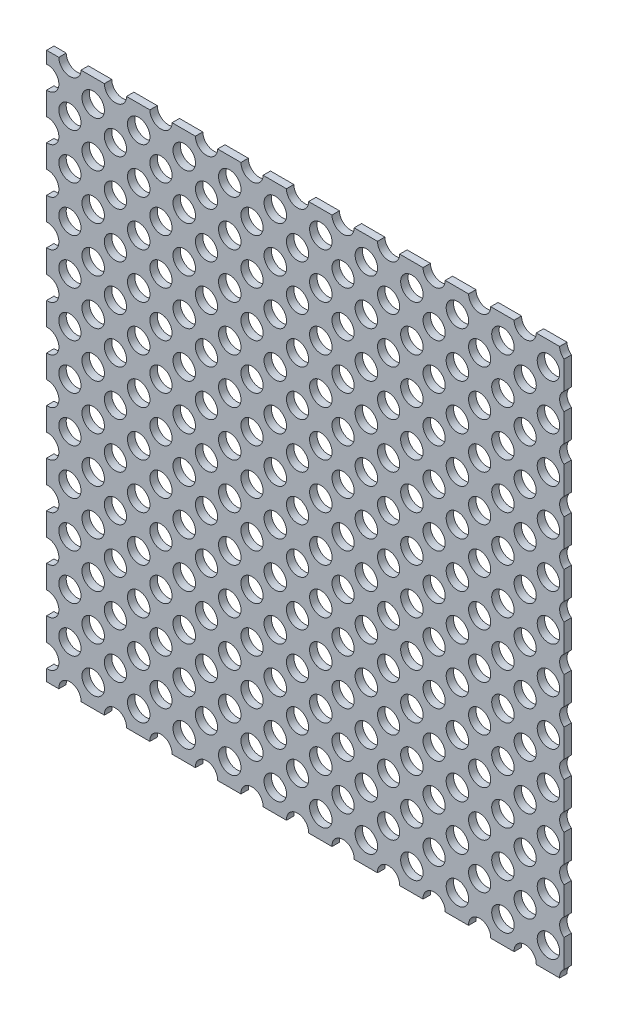
from build123d import *

# Parameters (mm, degrees)
SKETCH1_W                     = 222.25
SKETCH1_H                     = 234.95
BOSS_EXTRUDE1_DEPTH           = 3.175
SKETCH2_R                     = 4.7625
SKETCH2_R_2                   = 4.826
CUT_EXTRUDE1_DEPTH            = 3.175
LPATTERN1_COUNT               = 16
LPATTERN1_PITCH               = 19.558
LPATTERN1_COL_COUNT           = 2
LPATTERN1_COL_PITCH           = 19.558
LPATTERN2_COPY_1_SKETCH_R     = 4.7625
LPATTERN2_COPY_1_SKETCH_R_2   = 4.826
LPATTERN2_COPY_1_DEPTH        = 3.175
LPATTERN2_COPY_2_SKETCH_R     = 4.7625
LPATTERN2_COPY_2_SKETCH_R_2   = 4.826
LPATTERN2_COPY_2_DEPTH        = 3.175
LPATTERN2_COPY_3_SKETCH_R     = 4.7625
LPATTERN2_COPY_3_SKETCH_R_2   = 4.826
LPATTERN2_COPY_3_DEPTH        = 3.175
LPATTERN2_COPY_4_SKETCH_R     = 4.7625
LPATTERN2_COPY_4_SKETCH_R_2   = 4.826
LPATTERN2_COPY_4_DEPTH        = 3.175
LPATTERN2_COPY_5_SKETCH_R     = 4.7625
LPATTERN2_COPY_5_SKETCH_R_2   = 4.826
LPATTERN2_COPY_5_DEPTH        = 3.175
LPATTERN2_COPY_6_SKETCH_R     = 4.7625
LPATTERN2_COPY_6_SKETCH_R_2   = 4.826
LPATTERN2_COPY_6_DEPTH        = 3.175
LPATTERN2_COPY_7_SKETCH_R     = 4.7625
LPATTERN2_COPY_7_SKETCH_R_2   = 4.826
LPATTERN2_COPY_7_DEPTH        = 3.175
LPATTERN2_COPY_8_SKETCH_R     = 4.7625
LPATTERN2_COPY_8_SKETCH_R_2   = 4.826
LPATTERN2_COPY_8_DEPTH        = 3.175
LPATTERN2_COPY_9_SKETCH_R     = 4.7625
LPATTERN2_COPY_9_SKETCH_R_2   = 4.826
LPATTERN2_COPY_9_DEPTH        = 3.175
LPATTERN2_COPY_10_SKETCH_R    = 4.7625
LPATTERN2_COPY_10_SKETCH_R_2  = 4.826
LPATTERN2_COPY_10_DEPTH       = 3.175
LPATTERN2_COPY_11_SKETCH_R    = 4.7625
LPATTERN2_COPY_11_SKETCH_R_2  = 4.826
LPATTERN2_COPY_11_DEPTH       = 3.175
LPATTERN2_COPY_12_SKETCH_R    = 4.7625
LPATTERN2_COPY_12_SKETCH_R_2  = 4.826
LPATTERN2_COPY_12_DEPTH       = 3.175
LPATTERN2_COPY_13_SKETCH_R    = 4.7625
LPATTERN2_COPY_13_SKETCH_R_2  = 4.826
LPATTERN2_COPY_13_DEPTH       = 3.175
LPATTERN2_COPY_14_SKETCH_R    = 4.7625
LPATTERN2_COPY_14_SKETCH_R_2  = 4.826
LPATTERN2_COPY_14_DEPTH       = 3.175
LPATTERN2_COPY_15_SKETCH_R    = 4.7625
LPATTERN2_COPY_15_SKETCH_R_2  = 4.826
LPATTERN2_COPY_15_DEPTH       = 3.175
LPATTERN2_COPY_16_SKETCH_R    = 4.7625
LPATTERN2_COPY_16_SKETCH_R_2  = 4.826
LPATTERN2_COPY_16_DEPTH       = 3.175
LPATTERN2_COPY_17_SKETCH_R    = 4.7625
LPATTERN2_COPY_17_SKETCH_R_2  = 4.826
LPATTERN2_COPY_17_DEPTH       = 3.175
LPATTERN2_COPY_18_SKETCH_R    = 4.7625
LPATTERN2_COPY_18_SKETCH_R_2  = 4.826
LPATTERN2_COPY_18_DEPTH       = 3.175
LPATTERN2_COPY_19_SKETCH_R    = 4.7625
LPATTERN2_COPY_19_SKETCH_R_2  = 4.826
LPATTERN2_COPY_19_DEPTH       = 3.175
LPATTERN2_COPY_20_SKETCH_R    = 4.7625
LPATTERN2_COPY_20_SKETCH_R_2  = 4.826
LPATTERN2_COPY_20_DEPTH       = 3.175
LPATTERN2_COPY_21_SKETCH_R    = 4.7625
LPATTERN2_COPY_21_SKETCH_R_2  = 4.826
LPATTERN2_COPY_21_DEPTH       = 3.175
LPATTERN2_COPY_22_SKETCH_R    = 4.7625
LPATTERN2_COPY_22_SKETCH_R_2  = 4.826
LPATTERN2_COPY_22_DEPTH       = 3.175
LPATTERN2_COPY_23_SKETCH_R    = 4.7625
LPATTERN2_COPY_23_SKETCH_R_2  = 4.826
LPATTERN2_COPY_23_DEPTH       = 3.175
LPATTERN2_COPY_24_SKETCH_R    = 4.7625
LPATTERN2_COPY_24_SKETCH_R_2  = 4.826
LPATTERN2_COPY_24_DEPTH       = 3.175
LPATTERN2_COPY_25_SKETCH_R    = 4.7625
LPATTERN2_COPY_25_SKETCH_R_2  = 4.826
LPATTERN2_COPY_25_DEPTH       = 3.175
LPATTERN2_COPY_26_SKETCH_R    = 4.7625
LPATTERN2_COPY_26_SKETCH_R_2  = 4.826
LPATTERN2_COPY_26_DEPTH       = 3.175
LPATTERN2_COPY_27_SKETCH_R    = 4.7625
LPATTERN2_COPY_27_SKETCH_R_2  = 4.826
LPATTERN2_COPY_27_DEPTH       = 3.175
LPATTERN2_COPY_28_SKETCH_R    = 4.7625
LPATTERN2_COPY_28_SKETCH_R_2  = 4.826
LPATTERN2_COPY_28_DEPTH       = 3.175
LPATTERN2_COPY_29_SKETCH_R    = 4.7625
LPATTERN2_COPY_29_SKETCH_R_2  = 4.826
LPATTERN2_COPY_29_DEPTH       = 3.175
LPATTERN2_COPY_30_SKETCH_R    = 4.7625
LPATTERN2_COPY_30_SKETCH_R_2  = 4.826
LPATTERN2_COPY_30_DEPTH       = 3.175
LPATTERN2_COPY_31_SKETCH_R    = 4.7625
LPATTERN2_COPY_31_SKETCH_R_2  = 4.826
LPATTERN2_COPY_31_DEPTH       = 3.175
LPATTERN2_COPY_32_SKETCH_R    = 4.7625
LPATTERN2_COPY_32_SKETCH_R_2  = 4.826
LPATTERN2_COPY_32_DEPTH       = 3.175
LPATTERN2_COPY_33_SKETCH_R    = 4.7625
LPATTERN2_COPY_33_SKETCH_R_2  = 4.826
LPATTERN2_COPY_33_DEPTH       = 3.175
LPATTERN2_COPY_34_SKETCH_R    = 4.7625
LPATTERN2_COPY_34_SKETCH_R_2  = 4.826
LPATTERN2_COPY_34_DEPTH       = 3.175
LPATTERN2_COPY_35_SKETCH_R    = 4.7625
LPATTERN2_COPY_35_SKETCH_R_2  = 4.826
LPATTERN2_COPY_35_DEPTH       = 3.175
LPATTERN2_COPY_36_SKETCH_R    = 4.7625
LPATTERN2_COPY_36_SKETCH_R_2  = 4.826
LPATTERN2_COPY_36_DEPTH       = 3.175
LPATTERN2_COPY_37_SKETCH_R    = 4.7625
LPATTERN2_COPY_37_SKETCH_R_2  = 4.826
LPATTERN2_COPY_37_DEPTH       = 3.175
LPATTERN2_COPY_38_SKETCH_R    = 4.7625
LPATTERN2_COPY_38_SKETCH_R_2  = 4.826
LPATTERN2_COPY_38_DEPTH       = 3.175
LPATTERN2_COPY_39_SKETCH_R    = 4.7625
LPATTERN2_COPY_39_SKETCH_R_2  = 4.826
LPATTERN2_COPY_39_DEPTH       = 3.175
LPATTERN2_COPY_40_SKETCH_R    = 4.7625
LPATTERN2_COPY_40_SKETCH_R_2  = 4.826
LPATTERN2_COPY_40_DEPTH       = 3.175
LPATTERN2_COPY_41_SKETCH_R    = 4.7625
LPATTERN2_COPY_41_SKETCH_R_2  = 4.826
LPATTERN2_COPY_41_DEPTH       = 3.175
LPATTERN2_COPY_42_SKETCH_R    = 4.7625
LPATTERN2_COPY_42_SKETCH_R_2  = 4.826
LPATTERN2_COPY_42_DEPTH       = 3.175
LPATTERN2_COPY_43_SKETCH_R    = 4.7625
LPATTERN2_COPY_43_SKETCH_R_2  = 4.826
LPATTERN2_COPY_43_DEPTH       = 3.175
LPATTERN2_COPY_44_SKETCH_R    = 4.7625
LPATTERN2_COPY_44_SKETCH_R_2  = 4.826
LPATTERN2_COPY_44_DEPTH       = 3.175
LPATTERN2_COPY_45_SKETCH_R    = 4.7625
LPATTERN2_COPY_45_SKETCH_R_2  = 4.826
LPATTERN2_COPY_45_DEPTH       = 3.175
LPATTERN2_COPY_46_SKETCH_R    = 4.7625
LPATTERN2_COPY_46_SKETCH_R_2  = 4.826
LPATTERN2_COPY_46_DEPTH       = 3.175
LPATTERN2_COPY_47_SKETCH_R    = 4.7625
LPATTERN2_COPY_47_SKETCH_R_2  = 4.826
LPATTERN2_COPY_47_DEPTH       = 3.175
LPATTERN2_COPY_48_SKETCH_R    = 4.7625
LPATTERN2_COPY_48_SKETCH_R_2  = 4.826
LPATTERN2_COPY_48_DEPTH       = 3.175
LPATTERN2_COPY_49_SKETCH_R    = 4.7625
LPATTERN2_COPY_49_SKETCH_R_2  = 4.826
LPATTERN2_COPY_49_DEPTH       = 3.175
LPATTERN2_COPY_50_SKETCH_R    = 4.7625
LPATTERN2_COPY_50_SKETCH_R_2  = 4.826
LPATTERN2_COPY_50_DEPTH       = 3.175
LPATTERN2_COPY_51_SKETCH_R    = 4.7625
LPATTERN2_COPY_51_SKETCH_R_2  = 4.826
LPATTERN2_COPY_51_DEPTH       = 3.175
LPATTERN2_COPY_52_SKETCH_R    = 4.7625
LPATTERN2_COPY_52_SKETCH_R_2  = 4.826
LPATTERN2_COPY_52_DEPTH       = 3.175
LPATTERN2_COPY_53_SKETCH_R    = 4.7625
LPATTERN2_COPY_53_SKETCH_R_2  = 4.826
LPATTERN2_COPY_53_DEPTH       = 3.175
LPATTERN2_COPY_54_SKETCH_R    = 4.7625
LPATTERN2_COPY_54_SKETCH_R_2  = 4.826
LPATTERN2_COPY_54_DEPTH       = 3.175
LPATTERN2_COPY_55_SKETCH_R    = 4.7625
LPATTERN2_COPY_55_SKETCH_R_2  = 4.826
LPATTERN2_COPY_55_DEPTH       = 3.175
LPATTERN2_COPY_56_SKETCH_R    = 4.7625
LPATTERN2_COPY_56_SKETCH_R_2  = 4.826
LPATTERN2_COPY_56_DEPTH       = 3.175
LPATTERN2_COPY_57_SKETCH_R    = 4.7625
LPATTERN2_COPY_57_SKETCH_R_2  = 4.826
LPATTERN2_COPY_57_DEPTH       = 3.175
LPATTERN2_COPY_58_SKETCH_R    = 4.7625
LPATTERN2_COPY_58_SKETCH_R_2  = 4.826
LPATTERN2_COPY_58_DEPTH       = 3.175
LPATTERN2_COPY_59_SKETCH_R    = 4.7625
LPATTERN2_COPY_59_SKETCH_R_2  = 4.826
LPATTERN2_COPY_59_DEPTH       = 3.175
LPATTERN2_COPY_60_SKETCH_R    = 4.7625
LPATTERN2_COPY_60_SKETCH_R_2  = 4.826
LPATTERN2_COPY_60_DEPTH       = 3.175
LPATTERN2_COPY_61_SKETCH_R    = 4.7625
LPATTERN2_COPY_61_SKETCH_R_2  = 4.826
LPATTERN2_COPY_61_DEPTH       = 3.175
LPATTERN2_COPY_62_SKETCH_R    = 4.7625
LPATTERN2_COPY_62_SKETCH_R_2  = 4.826
LPATTERN2_COPY_62_DEPTH       = 3.175
LPATTERN2_COPY_63_SKETCH_R    = 4.7625
LPATTERN2_COPY_63_SKETCH_R_2  = 4.826
LPATTERN2_COPY_63_DEPTH       = 3.175
LPATTERN2_COPY_64_SKETCH_R    = 4.7625
LPATTERN2_COPY_64_SKETCH_R_2  = 4.826
LPATTERN2_COPY_64_DEPTH       = 3.175
LPATTERN2_COPY_65_SKETCH_R    = 4.7625
LPATTERN2_COPY_65_SKETCH_R_2  = 4.826
LPATTERN2_COPY_65_DEPTH       = 3.175
LPATTERN2_COPY_66_SKETCH_R    = 4.7625
LPATTERN2_COPY_66_SKETCH_R_2  = 4.826
LPATTERN2_COPY_66_DEPTH       = 3.175
LPATTERN2_COPY_67_SKETCH_R    = 4.7625
LPATTERN2_COPY_67_SKETCH_R_2  = 4.826
LPATTERN2_COPY_67_DEPTH       = 3.175
LPATTERN2_COPY_68_SKETCH_R    = 4.7625
LPATTERN2_COPY_68_SKETCH_R_2  = 4.826
LPATTERN2_COPY_68_DEPTH       = 3.175
LPATTERN2_COPY_69_SKETCH_R    = 4.7625
LPATTERN2_COPY_69_SKETCH_R_2  = 4.826
LPATTERN2_COPY_69_DEPTH       = 3.175
LPATTERN2_COPY_70_SKETCH_R    = 4.7625
LPATTERN2_COPY_70_SKETCH_R_2  = 4.826
LPATTERN2_COPY_70_DEPTH       = 3.175
LPATTERN2_COPY_71_SKETCH_R    = 4.7625
LPATTERN2_COPY_71_SKETCH_R_2  = 4.826
LPATTERN2_COPY_71_DEPTH       = 3.175
LPATTERN2_COPY_72_SKETCH_R    = 4.7625
LPATTERN2_COPY_72_SKETCH_R_2  = 4.826
LPATTERN2_COPY_72_DEPTH       = 3.175
LPATTERN2_COPY_73_SKETCH_R    = 4.7625
LPATTERN2_COPY_73_SKETCH_R_2  = 4.826
LPATTERN2_COPY_73_DEPTH       = 3.175
LPATTERN2_COPY_74_SKETCH_R    = 4.7625
LPATTERN2_COPY_74_SKETCH_R_2  = 4.826
LPATTERN2_COPY_74_DEPTH       = 3.175
LPATTERN2_COPY_75_SKETCH_R    = 4.7625
LPATTERN2_COPY_75_SKETCH_R_2  = 4.826
LPATTERN2_COPY_75_DEPTH       = 3.175
LPATTERN2_COPY_76_SKETCH_R    = 4.7625
LPATTERN2_COPY_76_SKETCH_R_2  = 4.826
LPATTERN2_COPY_76_DEPTH       = 3.175
LPATTERN2_COPY_77_SKETCH_R    = 4.7625
LPATTERN2_COPY_77_SKETCH_R_2  = 4.826
LPATTERN2_COPY_77_DEPTH       = 3.175
LPATTERN2_COPY_78_SKETCH_R    = 4.7625
LPATTERN2_COPY_78_SKETCH_R_2  = 4.826
LPATTERN2_COPY_78_DEPTH       = 3.175
LPATTERN2_COPY_79_SKETCH_R    = 4.7625
LPATTERN2_COPY_79_SKETCH_R_2  = 4.826
LPATTERN2_COPY_79_DEPTH       = 3.175
LPATTERN2_COPY_80_SKETCH_R    = 4.7625
LPATTERN2_COPY_80_SKETCH_R_2  = 4.826
LPATTERN2_COPY_80_DEPTH       = 3.175
LPATTERN2_COPY_81_SKETCH_R    = 4.7625
LPATTERN2_COPY_81_SKETCH_R_2  = 4.826
LPATTERN2_COPY_81_DEPTH       = 3.175
LPATTERN2_COPY_82_SKETCH_R    = 4.7625
LPATTERN2_COPY_82_SKETCH_R_2  = 4.826
LPATTERN2_COPY_82_DEPTH       = 3.175
LPATTERN2_COPY_83_SKETCH_R    = 4.7625
LPATTERN2_COPY_83_SKETCH_R_2  = 4.826
LPATTERN2_COPY_83_DEPTH       = 3.175
LPATTERN2_COPY_84_SKETCH_R    = 4.7625
LPATTERN2_COPY_84_SKETCH_R_2  = 4.826
LPATTERN2_COPY_84_DEPTH       = 3.175
LPATTERN2_COPY_85_SKETCH_R    = 4.7625
LPATTERN2_COPY_85_SKETCH_R_2  = 4.826
LPATTERN2_COPY_85_DEPTH       = 3.175
LPATTERN2_COPY_86_SKETCH_R    = 4.7625
LPATTERN2_COPY_86_SKETCH_R_2  = 4.826
LPATTERN2_COPY_86_DEPTH       = 3.175
LPATTERN2_COPY_87_SKETCH_R    = 4.7625
LPATTERN2_COPY_87_SKETCH_R_2  = 4.826
LPATTERN2_COPY_87_DEPTH       = 3.175
LPATTERN2_COPY_88_SKETCH_R    = 4.7625
LPATTERN2_COPY_88_SKETCH_R_2  = 4.826
LPATTERN2_COPY_88_DEPTH       = 3.175
LPATTERN2_COPY_89_SKETCH_R    = 4.7625
LPATTERN2_COPY_89_SKETCH_R_2  = 4.826
LPATTERN2_COPY_89_DEPTH       = 3.175
LPATTERN2_COPY_90_SKETCH_R    = 4.7625
LPATTERN2_COPY_90_SKETCH_R_2  = 4.826
LPATTERN2_COPY_90_DEPTH       = 3.175
LPATTERN2_COPY_91_SKETCH_R    = 4.7625
LPATTERN2_COPY_91_SKETCH_R_2  = 4.826
LPATTERN2_COPY_91_DEPTH       = 3.175
LPATTERN2_COPY_92_SKETCH_R    = 4.7625
LPATTERN2_COPY_92_SKETCH_R_2  = 4.826
LPATTERN2_COPY_92_DEPTH       = 3.175
LPATTERN2_COPY_93_SKETCH_R    = 4.7625
LPATTERN2_COPY_93_SKETCH_R_2  = 4.826
LPATTERN2_COPY_93_DEPTH       = 3.175
LPATTERN2_COPY_94_SKETCH_R    = 4.7625
LPATTERN2_COPY_94_SKETCH_R_2  = 4.826
LPATTERN2_COPY_94_DEPTH       = 3.175
LPATTERN2_COPY_95_SKETCH_R    = 4.7625
LPATTERN2_COPY_95_SKETCH_R_2  = 4.826
LPATTERN2_COPY_95_DEPTH       = 3.175
LPATTERN2_COPY_96_SKETCH_R    = 4.7625
LPATTERN2_COPY_96_SKETCH_R_2  = 4.826
LPATTERN2_COPY_96_DEPTH       = 3.175
LPATTERN2_COPY_97_SKETCH_R    = 4.7625
LPATTERN2_COPY_97_SKETCH_R_2  = 4.826
LPATTERN2_COPY_97_DEPTH       = 3.175
LPATTERN2_COPY_98_SKETCH_R    = 4.7625
LPATTERN2_COPY_98_SKETCH_R_2  = 4.826
LPATTERN2_COPY_98_DEPTH       = 3.175
LPATTERN2_COPY_99_SKETCH_R    = 4.7625
LPATTERN2_COPY_99_SKETCH_R_2  = 4.826
LPATTERN2_COPY_99_DEPTH       = 3.175
LPATTERN2_COPY_100_SKETCH_R   = 4.7625
LPATTERN2_COPY_100_SKETCH_R_2 = 4.826
LPATTERN2_COPY_100_DEPTH      = 3.175
LPATTERN2_COPY_101_SKETCH_R   = 4.7625
LPATTERN2_COPY_101_SKETCH_R_2 = 4.826
LPATTERN2_COPY_101_DEPTH      = 3.175
LPATTERN2_COPY_102_SKETCH_R   = 4.7625
LPATTERN2_COPY_102_SKETCH_R_2 = 4.826
LPATTERN2_COPY_102_DEPTH      = 3.175
LPATTERN2_COPY_103_SKETCH_R   = 4.7625
LPATTERN2_COPY_103_SKETCH_R_2 = 4.826
LPATTERN2_COPY_103_DEPTH      = 3.175
LPATTERN2_COPY_104_SKETCH_R   = 4.7625
LPATTERN2_COPY_104_SKETCH_R_2 = 4.826
LPATTERN2_COPY_104_DEPTH      = 3.175
LPATTERN2_COPY_105_SKETCH_R   = 4.7625
LPATTERN2_COPY_105_SKETCH_R_2 = 4.826
LPATTERN2_COPY_105_DEPTH      = 3.175
LPATTERN2_COPY_106_SKETCH_R   = 4.7625
LPATTERN2_COPY_106_SKETCH_R_2 = 4.826
LPATTERN2_COPY_106_DEPTH      = 3.175
LPATTERN2_COPY_107_SKETCH_R   = 4.7625
LPATTERN2_COPY_107_SKETCH_R_2 = 4.826
LPATTERN2_COPY_107_DEPTH      = 3.175
LPATTERN2_COPY_108_SKETCH_R   = 4.7625
LPATTERN2_COPY_108_SKETCH_R_2 = 4.826
LPATTERN2_COPY_108_DEPTH      = 3.175
LPATTERN2_COPY_109_SKETCH_R   = 4.7625
LPATTERN2_COPY_109_SKETCH_R_2 = 4.826
LPATTERN2_COPY_109_DEPTH      = 3.175
LPATTERN2_COPY_110_SKETCH_R   = 4.7625
LPATTERN2_COPY_110_SKETCH_R_2 = 4.826
LPATTERN2_COPY_110_DEPTH      = 3.175
LPATTERN2_COPY_111_SKETCH_R   = 4.7625
LPATTERN2_COPY_111_SKETCH_R_2 = 4.826
LPATTERN2_COPY_111_DEPTH      = 3.175
LPATTERN2_COPY_112_SKETCH_R   = 4.7625
LPATTERN2_COPY_112_SKETCH_R_2 = 4.826
LPATTERN2_COPY_112_DEPTH      = 3.175
LPATTERN2_COPY_113_SKETCH_R   = 4.7625
LPATTERN2_COPY_113_SKETCH_R_2 = 4.826
LPATTERN2_COPY_113_DEPTH      = 3.175
LPATTERN2_COPY_114_SKETCH_R   = 4.7625
LPATTERN2_COPY_114_SKETCH_R_2 = 4.826
LPATTERN2_COPY_114_DEPTH      = 3.175
LPATTERN2_COPY_115_SKETCH_R   = 4.7625
LPATTERN2_COPY_115_SKETCH_R_2 = 4.826
LPATTERN2_COPY_115_DEPTH      = 3.175
LPATTERN2_COPY_116_SKETCH_R   = 4.7625
LPATTERN2_COPY_116_SKETCH_R_2 = 4.826
LPATTERN2_COPY_116_DEPTH      = 3.175
LPATTERN2_COPY_117_SKETCH_R   = 4.7625
LPATTERN2_COPY_117_SKETCH_R_2 = 4.826
LPATTERN2_COPY_117_DEPTH      = 3.175
LPATTERN2_COPY_118_SKETCH_R   = 4.7625
LPATTERN2_COPY_118_SKETCH_R_2 = 4.826
LPATTERN2_COPY_118_DEPTH      = 3.175
LPATTERN2_COPY_119_SKETCH_R   = 4.7625
LPATTERN2_COPY_119_SKETCH_R_2 = 4.826
LPATTERN2_COPY_119_DEPTH      = 3.175
LPATTERN2_COPY_120_SKETCH_R   = 4.7625
LPATTERN2_COPY_120_SKETCH_R_2 = 4.826
LPATTERN2_COPY_120_DEPTH      = 3.175
LPATTERN2_COPY_121_SKETCH_R   = 4.7625
LPATTERN2_COPY_121_SKETCH_R_2 = 4.826
LPATTERN2_COPY_121_DEPTH      = 3.175
LPATTERN2_COPY_122_SKETCH_R   = 4.7625
LPATTERN2_COPY_122_SKETCH_R_2 = 4.826
LPATTERN2_COPY_122_DEPTH      = 3.175
LPATTERN2_COPY_123_SKETCH_R   = 4.7625
LPATTERN2_COPY_123_SKETCH_R_2 = 4.826
LPATTERN2_COPY_123_DEPTH      = 3.175
LPATTERN2_COPY_124_SKETCH_R   = 4.7625
LPATTERN2_COPY_124_SKETCH_R_2 = 4.826
LPATTERN2_COPY_124_DEPTH      = 3.175
LPATTERN2_COPY_125_SKETCH_R   = 4.7625
LPATTERN2_COPY_125_SKETCH_R_2 = 4.826
LPATTERN2_COPY_125_DEPTH      = 3.175
LPATTERN2_COPY_126_SKETCH_R   = 4.7625
LPATTERN2_COPY_126_SKETCH_R_2 = 4.826
LPATTERN2_COPY_126_DEPTH      = 3.175
LPATTERN2_COPY_127_SKETCH_R   = 4.7625
LPATTERN2_COPY_127_SKETCH_R_2 = 4.826
LPATTERN2_COPY_127_DEPTH      = 3.175
LPATTERN2_COPY_128_SKETCH_R   = 4.7625
LPATTERN2_COPY_128_SKETCH_R_2 = 4.826
LPATTERN2_COPY_128_DEPTH      = 3.175
LPATTERN2_COPY_129_SKETCH_R   = 4.7625
LPATTERN2_COPY_129_SKETCH_R_2 = 4.826
LPATTERN2_COPY_129_DEPTH      = 3.175
LPATTERN2_COPY_130_SKETCH_R   = 4.7625
LPATTERN2_COPY_130_SKETCH_R_2 = 4.826
LPATTERN2_COPY_130_DEPTH      = 3.175
LPATTERN2_COPY_131_SKETCH_R   = 4.7625
LPATTERN2_COPY_131_SKETCH_R_2 = 4.826
LPATTERN2_COPY_131_DEPTH      = 3.175
LPATTERN2_COPY_132_SKETCH_R   = 4.7625
LPATTERN2_COPY_132_SKETCH_R_2 = 4.826
LPATTERN2_COPY_132_DEPTH      = 3.175
LPATTERN2_COPY_133_SKETCH_R   = 4.7625
LPATTERN2_COPY_133_SKETCH_R_2 = 4.826
LPATTERN2_COPY_133_DEPTH      = 3.175
LPATTERN2_COPY_134_SKETCH_R   = 4.7625
LPATTERN2_COPY_134_SKETCH_R_2 = 4.826
LPATTERN2_COPY_134_DEPTH      = 3.175
LPATTERN2_COPY_135_SKETCH_R   = 4.7625
LPATTERN2_COPY_135_SKETCH_R_2 = 4.826
LPATTERN2_COPY_135_DEPTH      = 3.175
LPATTERN2_COPY_136_SKETCH_R   = 4.7625
LPATTERN2_COPY_136_SKETCH_R_2 = 4.826
LPATTERN2_COPY_136_DEPTH      = 3.175
LPATTERN2_COPY_137_SKETCH_R   = 4.7625
LPATTERN2_COPY_137_SKETCH_R_2 = 4.826
LPATTERN2_COPY_137_DEPTH      = 3.175
LPATTERN2_COPY_138_SKETCH_R   = 4.7625
LPATTERN2_COPY_138_SKETCH_R_2 = 4.826
LPATTERN2_COPY_138_DEPTH      = 3.175
LPATTERN2_COPY_139_SKETCH_R   = 4.7625
LPATTERN2_COPY_139_SKETCH_R_2 = 4.826
LPATTERN2_COPY_139_DEPTH      = 3.175
LPATTERN2_COPY_140_SKETCH_R   = 4.7625
LPATTERN2_COPY_140_SKETCH_R_2 = 4.826
LPATTERN2_COPY_140_DEPTH      = 3.175
LPATTERN2_COPY_141_SKETCH_R   = 4.7625
LPATTERN2_COPY_141_SKETCH_R_2 = 4.826
LPATTERN2_COPY_141_DEPTH      = 3.175
LPATTERN2_COPY_142_SKETCH_R   = 4.7625
LPATTERN2_COPY_142_SKETCH_R_2 = 4.826
LPATTERN2_COPY_142_DEPTH      = 3.175
LPATTERN2_COPY_143_SKETCH_R   = 4.7625
LPATTERN2_COPY_143_SKETCH_R_2 = 4.826
LPATTERN2_COPY_143_DEPTH      = 3.175
LPATTERN2_COPY_144_SKETCH_R   = 4.7625
LPATTERN2_COPY_144_SKETCH_R_2 = 4.826
LPATTERN2_COPY_144_DEPTH      = 3.175
LPATTERN2_COPY_145_SKETCH_R   = 4.7625
LPATTERN2_COPY_145_SKETCH_R_2 = 4.826
LPATTERN2_COPY_145_DEPTH      = 3.175
LPATTERN2_COPY_146_SKETCH_R   = 4.7625
LPATTERN2_COPY_146_SKETCH_R_2 = 4.826
LPATTERN2_COPY_146_DEPTH      = 3.175
LPATTERN2_COPY_147_SKETCH_R   = 4.7625
LPATTERN2_COPY_147_SKETCH_R_2 = 4.826
LPATTERN2_COPY_147_DEPTH      = 3.175
LPATTERN2_COPY_148_SKETCH_R   = 4.7625
LPATTERN2_COPY_148_SKETCH_R_2 = 4.826
LPATTERN2_COPY_148_DEPTH      = 3.175
LPATTERN2_COPY_149_SKETCH_R   = 4.7625
LPATTERN2_COPY_149_SKETCH_R_2 = 4.826
LPATTERN2_COPY_149_DEPTH      = 3.175
LPATTERN2_COPY_150_SKETCH_R   = 4.7625
LPATTERN2_COPY_150_SKETCH_R_2 = 4.826
LPATTERN2_COPY_150_DEPTH      = 3.175
LPATTERN2_COPY_151_SKETCH_R   = 4.7625
LPATTERN2_COPY_151_SKETCH_R_2 = 4.826
LPATTERN2_COPY_151_DEPTH      = 3.175
LPATTERN2_COPY_152_SKETCH_R   = 4.7625
LPATTERN2_COPY_152_SKETCH_R_2 = 4.826
LPATTERN2_COPY_152_DEPTH      = 3.175
LPATTERN2_COPY_153_SKETCH_R   = 4.7625
LPATTERN2_COPY_153_SKETCH_R_2 = 4.826
LPATTERN2_COPY_153_DEPTH      = 3.175
LPATTERN2_COPY_154_SKETCH_R   = 4.7625
LPATTERN2_COPY_154_SKETCH_R_2 = 4.826
LPATTERN2_COPY_154_DEPTH      = 3.175
LPATTERN2_COPY_155_SKETCH_R   = 4.7625
LPATTERN2_COPY_155_SKETCH_R_2 = 4.826
LPATTERN2_COPY_155_DEPTH      = 3.175
LPATTERN2_COPY_156_SKETCH_R   = 4.7625
LPATTERN2_COPY_156_SKETCH_R_2 = 4.826
LPATTERN2_COPY_156_DEPTH      = 3.175
LPATTERN2_COPY_157_SKETCH_R   = 4.7625
LPATTERN2_COPY_157_SKETCH_R_2 = 4.826
LPATTERN2_COPY_157_DEPTH      = 3.175
LPATTERN2_COPY_158_SKETCH_R   = 4.7625
LPATTERN2_COPY_158_SKETCH_R_2 = 4.826
LPATTERN2_COPY_158_DEPTH      = 3.175
LPATTERN2_COPY_159_SKETCH_R   = 4.7625
LPATTERN2_COPY_159_SKETCH_R_2 = 4.826
LPATTERN2_COPY_159_DEPTH      = 3.175
LPATTERN2_COPY_160_SKETCH_R   = 4.7625
LPATTERN2_COPY_160_SKETCH_R_2 = 4.826
LPATTERN2_COPY_160_DEPTH      = 3.175
LPATTERN2_COPY_161_SKETCH_R   = 4.7625
LPATTERN2_COPY_161_SKETCH_R_2 = 4.826
LPATTERN2_COPY_161_DEPTH      = 3.175
LPATTERN2_COPY_162_SKETCH_R   = 4.7625
LPATTERN2_COPY_162_SKETCH_R_2 = 4.826
LPATTERN2_COPY_162_DEPTH      = 3.175
LPATTERN2_COPY_163_SKETCH_R   = 4.7625
LPATTERN2_COPY_163_SKETCH_R_2 = 4.826
LPATTERN2_COPY_163_DEPTH      = 3.175
LPATTERN2_COPY_164_SKETCH_R   = 4.7625
LPATTERN2_COPY_164_SKETCH_R_2 = 4.826
LPATTERN2_COPY_164_DEPTH      = 3.175
LPATTERN2_COPY_165_SKETCH_R   = 4.7625
LPATTERN2_COPY_165_SKETCH_R_2 = 4.826
LPATTERN2_COPY_165_DEPTH      = 3.175
LPATTERN2_COPY_166_SKETCH_R   = 4.7625
LPATTERN2_COPY_166_SKETCH_R_2 = 4.826
LPATTERN2_COPY_166_DEPTH      = 3.175
LPATTERN2_COPY_167_SKETCH_R   = 4.7625
LPATTERN2_COPY_167_SKETCH_R_2 = 4.826
LPATTERN2_COPY_167_DEPTH      = 3.175
LPATTERN2_COPY_168_SKETCH_R   = 4.7625
LPATTERN2_COPY_168_SKETCH_R_2 = 4.826
LPATTERN2_COPY_168_DEPTH      = 3.175
LPATTERN2_COPY_169_SKETCH_R   = 4.7625
LPATTERN2_COPY_169_SKETCH_R_2 = 4.826
LPATTERN2_COPY_169_DEPTH      = 3.175
LPATTERN2_COPY_170_SKETCH_R   = 4.7625
LPATTERN2_COPY_170_SKETCH_R_2 = 4.826
LPATTERN2_COPY_170_DEPTH      = 3.175
LPATTERN2_COPY_171_SKETCH_R   = 4.7625
LPATTERN2_COPY_171_SKETCH_R_2 = 4.826
LPATTERN2_COPY_171_DEPTH      = 3.175
LPATTERN2_COPY_172_SKETCH_R   = 4.7625
LPATTERN2_COPY_172_SKETCH_R_2 = 4.826
LPATTERN2_COPY_172_DEPTH      = 3.175
LPATTERN2_COPY_173_SKETCH_R   = 4.7625
LPATTERN2_COPY_173_SKETCH_R_2 = 4.826
LPATTERN2_COPY_173_DEPTH      = 3.175
LPATTERN2_COPY_174_SKETCH_R   = 4.7625
LPATTERN2_COPY_174_SKETCH_R_2 = 4.826
LPATTERN2_COPY_174_DEPTH      = 3.175
LPATTERN2_COPY_175_SKETCH_R   = 4.7625
LPATTERN2_COPY_175_SKETCH_R_2 = 4.826
LPATTERN2_COPY_175_DEPTH      = 3.175
LPATTERN2_COPY_176_SKETCH_R   = 4.7625
LPATTERN2_COPY_176_SKETCH_R_2 = 4.826
LPATTERN2_COPY_176_DEPTH      = 3.175
LPATTERN2_COPY_177_SKETCH_R   = 4.7625
LPATTERN2_COPY_177_SKETCH_R_2 = 4.826
LPATTERN2_COPY_177_DEPTH      = 3.175
LPATTERN2_COPY_178_SKETCH_R   = 4.7625
LPATTERN2_COPY_178_SKETCH_R_2 = 4.826
LPATTERN2_COPY_178_DEPTH      = 3.175
LPATTERN2_COPY_179_SKETCH_R   = 4.7625
LPATTERN2_COPY_179_SKETCH_R_2 = 4.826
LPATTERN2_COPY_179_DEPTH      = 3.175
LPATTERN2_COPY_180_SKETCH_R   = 4.7625
LPATTERN2_COPY_180_SKETCH_R_2 = 4.826
LPATTERN2_COPY_180_DEPTH      = 3.175
LPATTERN2_COPY_181_SKETCH_R   = 4.7625
LPATTERN2_COPY_181_SKETCH_R_2 = 4.826
LPATTERN2_COPY_181_DEPTH      = 3.175
LPATTERN2_COPY_182_SKETCH_R   = 4.7625
LPATTERN2_COPY_182_SKETCH_R_2 = 4.826
LPATTERN2_COPY_182_DEPTH      = 3.175
LPATTERN2_COPY_183_SKETCH_R   = 4.7625
LPATTERN2_COPY_183_SKETCH_R_2 = 4.826
LPATTERN2_COPY_183_DEPTH      = 3.175
LPATTERN2_COPY_184_SKETCH_R   = 4.7625
LPATTERN2_COPY_184_SKETCH_R_2 = 4.826
LPATTERN2_COPY_184_DEPTH      = 3.175
LPATTERN2_COPY_185_SKETCH_R   = 4.7625
LPATTERN2_COPY_185_SKETCH_R_2 = 4.826
LPATTERN2_COPY_185_DEPTH      = 3.175
LPATTERN2_COPY_186_SKETCH_R   = 4.7625
LPATTERN2_COPY_186_SKETCH_R_2 = 4.826
LPATTERN2_COPY_186_DEPTH      = 3.175
LPATTERN2_COPY_187_SKETCH_R   = 4.7625
LPATTERN2_COPY_187_SKETCH_R_2 = 4.826
LPATTERN2_COPY_187_DEPTH      = 3.175
LPATTERN2_COPY_188_SKETCH_R   = 4.7625
LPATTERN2_COPY_188_SKETCH_R_2 = 4.826
LPATTERN2_COPY_188_DEPTH      = 3.175
LPATTERN2_COPY_189_SKETCH_R   = 4.7625
LPATTERN2_COPY_189_SKETCH_R_2 = 4.826
LPATTERN2_COPY_189_DEPTH      = 3.175
LPATTERN2_COPY_190_SKETCH_R   = 4.7625
LPATTERN2_COPY_190_SKETCH_R_2 = 4.826
LPATTERN2_COPY_190_DEPTH      = 3.175
LPATTERN2_COPY_191_SKETCH_R   = 4.7625
LPATTERN2_COPY_191_SKETCH_R_2 = 4.826
LPATTERN2_COPY_191_DEPTH      = 3.175
LPATTERN2_COPY_192_SKETCH_R   = 4.7625
LPATTERN2_COPY_192_SKETCH_R_2 = 4.826
LPATTERN2_COPY_192_DEPTH      = 3.175
LPATTERN2_COPY_193_SKETCH_R   = 4.7625
LPATTERN2_COPY_193_SKETCH_R_2 = 4.826
LPATTERN2_COPY_193_DEPTH      = 3.175
LPATTERN2_COPY_194_SKETCH_R   = 4.7625
LPATTERN2_COPY_194_SKETCH_R_2 = 4.826
LPATTERN2_COPY_194_DEPTH      = 3.175
LPATTERN2_COPY_195_SKETCH_R   = 4.7625
LPATTERN2_COPY_195_SKETCH_R_2 = 4.826
LPATTERN2_COPY_195_DEPTH      = 3.175
LPATTERN2_COPY_196_SKETCH_R   = 4.7625
LPATTERN2_COPY_196_SKETCH_R_2 = 4.826
LPATTERN2_COPY_196_DEPTH      = 3.175
LPATTERN2_COPY_197_SKETCH_R   = 4.7625
LPATTERN2_COPY_197_SKETCH_R_2 = 4.826
LPATTERN2_COPY_197_DEPTH      = 3.175
LPATTERN2_COPY_198_SKETCH_R   = 4.7625
LPATTERN2_COPY_198_SKETCH_R_2 = 4.826
LPATTERN2_COPY_198_DEPTH      = 3.175
LPATTERN2_COPY_199_SKETCH_R   = 4.7625
LPATTERN2_COPY_199_SKETCH_R_2 = 4.826
LPATTERN2_COPY_199_DEPTH      = 3.175
LPATTERN2_COPY_200_SKETCH_R   = 4.7625
LPATTERN2_COPY_200_SKETCH_R_2 = 4.826
LPATTERN2_COPY_200_DEPTH      = 3.175
LPATTERN2_COPY_201_SKETCH_R   = 4.7625
LPATTERN2_COPY_201_SKETCH_R_2 = 4.826
LPATTERN2_COPY_201_DEPTH      = 3.175
LPATTERN2_COPY_202_SKETCH_R   = 4.7625
LPATTERN2_COPY_202_SKETCH_R_2 = 4.826
LPATTERN2_COPY_202_DEPTH      = 3.175
LPATTERN2_COPY_203_SKETCH_R   = 4.7625
LPATTERN2_COPY_203_SKETCH_R_2 = 4.826
LPATTERN2_COPY_203_DEPTH      = 3.175
LPATTERN2_COPY_204_SKETCH_R   = 4.7625
LPATTERN2_COPY_204_SKETCH_R_2 = 4.826
LPATTERN2_COPY_204_DEPTH      = 3.175
LPATTERN2_COPY_205_SKETCH_R   = 4.7625
LPATTERN2_COPY_205_SKETCH_R_2 = 4.826
LPATTERN2_COPY_205_DEPTH      = 3.175
LPATTERN2_COPY_206_SKETCH_R   = 4.7625
LPATTERN2_COPY_206_SKETCH_R_2 = 4.826
LPATTERN2_COPY_206_DEPTH      = 3.175
LPATTERN2_COPY_207_SKETCH_R   = 4.7625
LPATTERN2_COPY_207_SKETCH_R_2 = 4.826
LPATTERN2_COPY_207_DEPTH      = 3.175
LPATTERN2_COPY_208_SKETCH_R   = 4.7625
LPATTERN2_COPY_208_SKETCH_R_2 = 4.826
LPATTERN2_COPY_208_DEPTH      = 3.175
LPATTERN2_COPY_209_SKETCH_R   = 4.7625
LPATTERN2_COPY_209_SKETCH_R_2 = 4.826
LPATTERN2_COPY_209_DEPTH      = 3.175
LPATTERN2_COPY_210_SKETCH_R   = 4.7625
LPATTERN2_COPY_210_SKETCH_R_2 = 4.826
LPATTERN2_COPY_210_DEPTH      = 3.175
LPATTERN2_COPY_211_SKETCH_R   = 4.7625
LPATTERN2_COPY_211_SKETCH_R_2 = 4.826
LPATTERN2_COPY_211_DEPTH      = 3.175
LPATTERN2_COPY_212_SKETCH_R   = 4.7625
LPATTERN2_COPY_212_SKETCH_R_2 = 4.826
LPATTERN2_COPY_212_DEPTH      = 3.175
LPATTERN2_COPY_213_SKETCH_R   = 4.7625
LPATTERN2_COPY_213_SKETCH_R_2 = 4.826
LPATTERN2_COPY_213_DEPTH      = 3.175
LPATTERN2_COPY_214_SKETCH_R   = 4.7625
LPATTERN2_COPY_214_SKETCH_R_2 = 4.826
LPATTERN2_COPY_214_DEPTH      = 3.175
LPATTERN2_COPY_215_SKETCH_R   = 4.7625
LPATTERN2_COPY_215_SKETCH_R_2 = 4.826
LPATTERN2_COPY_215_DEPTH      = 3.175
LPATTERN2_COPY_216_SKETCH_R   = 4.7625
LPATTERN2_COPY_216_SKETCH_R_2 = 4.826
LPATTERN2_COPY_216_DEPTH      = 3.175
LPATTERN2_COPY_217_SKETCH_R   = 4.7625
LPATTERN2_COPY_217_SKETCH_R_2 = 4.826
LPATTERN2_COPY_217_DEPTH      = 3.175
LPATTERN2_COPY_218_SKETCH_R   = 4.7625
LPATTERN2_COPY_218_SKETCH_R_2 = 4.826
LPATTERN2_COPY_218_DEPTH      = 3.175
LPATTERN2_COPY_219_SKETCH_R   = 4.7625
LPATTERN2_COPY_219_SKETCH_R_2 = 4.826
LPATTERN2_COPY_219_DEPTH      = 3.175
LPATTERN2_COPY_220_SKETCH_R   = 4.7625
LPATTERN2_COPY_220_SKETCH_R_2 = 4.826
LPATTERN2_COPY_220_DEPTH      = 3.175
LPATTERN2_COPY_221_SKETCH_R   = 4.7625
LPATTERN2_COPY_221_SKETCH_R_2 = 4.826
LPATTERN2_COPY_221_DEPTH      = 3.175
LPATTERN2_COPY_222_SKETCH_R   = 4.7625
LPATTERN2_COPY_222_SKETCH_R_2 = 4.826
LPATTERN2_COPY_222_DEPTH      = 3.175
LPATTERN2_COPY_223_SKETCH_R   = 4.7625
LPATTERN2_COPY_223_SKETCH_R_2 = 4.826
LPATTERN2_COPY_223_DEPTH      = 3.175
LPATTERN2_COPY_224_SKETCH_R   = 4.7625
LPATTERN2_COPY_224_SKETCH_R_2 = 4.826
LPATTERN2_COPY_224_DEPTH      = 3.175
LPATTERN2_COPY_225_SKETCH_R   = 4.7625
LPATTERN2_COPY_225_SKETCH_R_2 = 4.826
LPATTERN2_COPY_225_DEPTH      = 3.175
LPATTERN2_COPY_226_SKETCH_R   = 4.7625
LPATTERN2_COPY_226_SKETCH_R_2 = 4.826
LPATTERN2_COPY_226_DEPTH      = 3.175
LPATTERN2_COPY_227_SKETCH_R   = 4.7625
LPATTERN2_COPY_227_SKETCH_R_2 = 4.826
LPATTERN2_COPY_227_DEPTH      = 3.175
LPATTERN2_COPY_228_SKETCH_R   = 4.7625
LPATTERN2_COPY_228_SKETCH_R_2 = 4.826
LPATTERN2_COPY_228_DEPTH      = 3.175
LPATTERN2_COPY_229_SKETCH_R   = 4.7625
LPATTERN2_COPY_229_SKETCH_R_2 = 4.826
LPATTERN2_COPY_229_DEPTH      = 3.175
LPATTERN2_COPY_230_SKETCH_R   = 4.7625
LPATTERN2_COPY_230_SKETCH_R_2 = 4.826
LPATTERN2_COPY_230_DEPTH      = 3.175
LPATTERN2_COPY_231_SKETCH_R   = 4.7625
LPATTERN2_COPY_231_SKETCH_R_2 = 4.826
LPATTERN2_COPY_231_DEPTH      = 3.175
LPATTERN2_COPY_232_SKETCH_R   = 4.7625
LPATTERN2_COPY_232_SKETCH_R_2 = 4.826
LPATTERN2_COPY_232_DEPTH      = 3.175
LPATTERN2_COPY_233_SKETCH_R   = 4.7625
LPATTERN2_COPY_233_SKETCH_R_2 = 4.826
LPATTERN2_COPY_233_DEPTH      = 3.175
LPATTERN2_COPY_234_SKETCH_R   = 4.7625
LPATTERN2_COPY_234_SKETCH_R_2 = 4.826
LPATTERN2_COPY_234_DEPTH      = 3.175
LPATTERN2_COPY_235_SKETCH_R   = 4.7625
LPATTERN2_COPY_235_SKETCH_R_2 = 4.826
LPATTERN2_COPY_235_DEPTH      = 3.175
LPATTERN2_COPY_236_SKETCH_R   = 4.7625
LPATTERN2_COPY_236_SKETCH_R_2 = 4.826
LPATTERN2_COPY_236_DEPTH      = 3.175
LPATTERN2_COPY_237_SKETCH_R   = 4.7625
LPATTERN2_COPY_237_SKETCH_R_2 = 4.826
LPATTERN2_COPY_237_DEPTH      = 3.175
LPATTERN2_COPY_238_SKETCH_R   = 4.7625
LPATTERN2_COPY_238_SKETCH_R_2 = 4.826
LPATTERN2_COPY_238_DEPTH      = 3.175
LPATTERN2_COPY_239_SKETCH_R   = 4.7625
LPATTERN2_COPY_239_SKETCH_R_2 = 4.826
LPATTERN2_COPY_239_DEPTH      = 3.175
LPATTERN2_COPY_240_SKETCH_R   = 4.7625
LPATTERN2_COPY_240_SKETCH_R_2 = 4.826
LPATTERN2_COPY_240_DEPTH      = 3.175
LPATTERN2_COPY_241_SKETCH_R   = 4.7625
LPATTERN2_COPY_241_SKETCH_R_2 = 4.826
LPATTERN2_COPY_241_DEPTH      = 3.175
LPATTERN2_COPY_242_SKETCH_R   = 4.7625
LPATTERN2_COPY_242_SKETCH_R_2 = 4.826
LPATTERN2_COPY_242_DEPTH      = 3.175
LPATTERN2_COPY_243_SKETCH_R   = 4.7625
LPATTERN2_COPY_243_SKETCH_R_2 = 4.826
LPATTERN2_COPY_243_DEPTH      = 3.175
LPATTERN2_COPY_244_SKETCH_R   = 4.7625
LPATTERN2_COPY_244_SKETCH_R_2 = 4.826
LPATTERN2_COPY_244_DEPTH      = 3.175
LPATTERN2_COPY_245_SKETCH_R   = 4.7625
LPATTERN2_COPY_245_SKETCH_R_2 = 4.826
LPATTERN2_COPY_245_DEPTH      = 3.175
LPATTERN2_COPY_246_SKETCH_R   = 4.7625
LPATTERN2_COPY_246_SKETCH_R_2 = 4.826
LPATTERN2_COPY_246_DEPTH      = 3.175
LPATTERN2_COPY_247_SKETCH_R   = 4.7625
LPATTERN2_COPY_247_SKETCH_R_2 = 4.826
LPATTERN2_COPY_247_DEPTH      = 3.175
LPATTERN2_COPY_248_SKETCH_R   = 4.7625
LPATTERN2_COPY_248_SKETCH_R_2 = 4.826
LPATTERN2_COPY_248_DEPTH      = 3.175
LPATTERN2_COPY_249_SKETCH_R   = 4.7625
LPATTERN2_COPY_249_SKETCH_R_2 = 4.826
LPATTERN2_COPY_249_DEPTH      = 3.175
LPATTERN2_COPY_250_SKETCH_R   = 4.7625
LPATTERN2_COPY_250_SKETCH_R_2 = 4.826
LPATTERN2_COPY_250_DEPTH      = 3.175
LPATTERN2_COPY_251_SKETCH_R   = 4.7625
LPATTERN2_COPY_251_SKETCH_R_2 = 4.826
LPATTERN2_COPY_251_DEPTH      = 3.175
LPATTERN2_COPY_252_SKETCH_R   = 4.7625
LPATTERN2_COPY_252_SKETCH_R_2 = 4.826
LPATTERN2_COPY_252_DEPTH      = 3.175
LPATTERN2_COPY_253_SKETCH_R   = 4.7625
LPATTERN2_COPY_253_SKETCH_R_2 = 4.826
LPATTERN2_COPY_253_DEPTH      = 3.175
LPATTERN2_COPY_254_SKETCH_R   = 4.7625
LPATTERN2_COPY_254_SKETCH_R_2 = 4.826
LPATTERN2_COPY_254_DEPTH      = 3.175
LPATTERN2_COPY_255_SKETCH_R   = 4.7625
LPATTERN2_COPY_255_SKETCH_R_2 = 4.826
LPATTERN2_COPY_255_DEPTH      = 3.175


with BuildPart() as part:
    # Sketch1 → Boss-Extrude1 (new body)
    with BuildSketch(Plane.XY):
        Rectangle(SKETCH1_W, SKETCH1_H)
    extrude(amount=-BOSS_EXTRUDE1_DEPTH)

    # Sketch2 → Cut-Extrude1 (cut)
    with BuildSketch(Plane.XY):
        with Locations((-101.125, 117.475)):
            Circle(SKETCH2_R)
        with Locations((-91.125, 107.475)):
            Circle(SKETCH2_R_2)
    cut_extrude1 = extrude(amount=-CUT_EXTRUDE1_DEPTH, mode=Mode.SUBTRACT)

    # LPattern1: Cut-Extrude1 ×16
    with Locations(*[(i * LPATTERN1_PITCH, 0, 0) for i in range(1, LPATTERN1_COUNT)]):
        add(cut_extrude1, mode=Mode.SUBTRACT)

    # LPattern1 col: Cut-Extrude1 ×2
    with Locations(*[(-i * LPATTERN1_COL_PITCH, 0, 0) for i in range(1, LPATTERN1_COL_COUNT)]):
        add(cut_extrude1, mode=Mode.SUBTRACT)

    # LPattern2 copy 1 sketch → LPattern2 copy 1 (cut)
    with BuildSketch(Plane(origin=(19.558, -19.558, 0), x_dir=(1, 0, 0), z_dir=(0, 0, 1))):
        with Locations((-101.125, 117.475)):
            Circle(LPATTERN2_COPY_1_SKETCH_R)
        with Locations((-91.125, 107.475)):
            Circle(LPATTERN2_COPY_1_SKETCH_R_2)
    extrude(amount=-LPATTERN2_COPY_1_DEPTH, mode=Mode.SUBTRACT)

    # LPattern2 copy 2 sketch → LPattern2 copy 2 (cut)
    with BuildSketch(Plane(origin=(19.558, -39.116, 0), x_dir=(1, 0, 0), z_dir=(0, 0, 1))):
        with Locations((-101.125, 117.475)):
            Circle(LPATTERN2_COPY_2_SKETCH_R)
        with Locations((-91.125, 107.475)):
            Circle(LPATTERN2_COPY_2_SKETCH_R_2)
    extrude(amount=-LPATTERN2_COPY_2_DEPTH, mode=Mode.SUBTRACT)

    # LPattern2 copy 3 sketch → LPattern2 copy 3 (cut)
    with BuildSketch(Plane(origin=(19.558, -58.674, 0), x_dir=(1, 0, 0), z_dir=(0, 0, 1))):
        with Locations((-101.125, 117.475)):
            Circle(LPATTERN2_COPY_3_SKETCH_R)
        with Locations((-91.125, 107.475)):
            Circle(LPATTERN2_COPY_3_SKETCH_R_2)
    extrude(amount=-LPATTERN2_COPY_3_DEPTH, mode=Mode.SUBTRACT)

    # LPattern2 copy 4 sketch → LPattern2 copy 4 (cut)
    with BuildSketch(Plane(origin=(19.558, -78.232, 0), x_dir=(1, 0, 0), z_dir=(0, 0, 1))):
        with Locations((-101.125, 117.475)):
            Circle(LPATTERN2_COPY_4_SKETCH_R)
        with Locations((-91.125, 107.475)):
            Circle(LPATTERN2_COPY_4_SKETCH_R_2)
    extrude(amount=-LPATTERN2_COPY_4_DEPTH, mode=Mode.SUBTRACT)

    # LPattern2 copy 5 sketch → LPattern2 copy 5 (cut)
    with BuildSketch(Plane(origin=(19.558, -97.79, 0), x_dir=(1, 0, 0), z_dir=(0, 0, 1))):
        with Locations((-101.125, 117.475)):
            Circle(LPATTERN2_COPY_5_SKETCH_R)
        with Locations((-91.125, 107.475)):
            Circle(LPATTERN2_COPY_5_SKETCH_R_2)
    extrude(amount=-LPATTERN2_COPY_5_DEPTH, mode=Mode.SUBTRACT)

    # LPattern2 copy 6 sketch → LPattern2 copy 6 (cut)
    with BuildSketch(Plane(origin=(19.558, -117.348, 0), x_dir=(1, 0, 0), z_dir=(0, 0, 1))):
        with Locations((-101.125, 117.475)):
            Circle(LPATTERN2_COPY_6_SKETCH_R)
        with Locations((-91.125, 107.475)):
            Circle(LPATTERN2_COPY_6_SKETCH_R_2)
    extrude(amount=-LPATTERN2_COPY_6_DEPTH, mode=Mode.SUBTRACT)

    # LPattern2 copy 7 sketch → LPattern2 copy 7 (cut)
    with BuildSketch(Plane(origin=(19.558, -136.906, 0), x_dir=(1, 0, 0), z_dir=(0, 0, 1))):
        with Locations((-101.125, 117.475)):
            Circle(LPATTERN2_COPY_7_SKETCH_R)
        with Locations((-91.125, 107.475)):
            Circle(LPATTERN2_COPY_7_SKETCH_R_2)
    extrude(amount=-LPATTERN2_COPY_7_DEPTH, mode=Mode.SUBTRACT)

    # LPattern2 copy 8 sketch → LPattern2 copy 8 (cut)
    with BuildSketch(Plane(origin=(19.558, -156.464, 0), x_dir=(1, 0, 0), z_dir=(0, 0, 1))):
        with Locations((-101.125, 117.475)):
            Circle(LPATTERN2_COPY_8_SKETCH_R)
        with Locations((-91.125, 107.475)):
            Circle(LPATTERN2_COPY_8_SKETCH_R_2)
    extrude(amount=-LPATTERN2_COPY_8_DEPTH, mode=Mode.SUBTRACT)

    # LPattern2 copy 9 sketch → LPattern2 copy 9 (cut)
    with BuildSketch(Plane(origin=(19.558, -176.022, 0), x_dir=(1, 0, 0), z_dir=(0, 0, 1))):
        with Locations((-101.125, 117.475)):
            Circle(LPATTERN2_COPY_9_SKETCH_R)
        with Locations((-91.125, 107.475)):
            Circle(LPATTERN2_COPY_9_SKETCH_R_2)
    extrude(amount=-LPATTERN2_COPY_9_DEPTH, mode=Mode.SUBTRACT)

    # LPattern2 copy 10 sketch → LPattern2 copy 10 (cut)
    with BuildSketch(Plane(origin=(19.558, -195.58, 0), x_dir=(1, 0, 0), z_dir=(0, 0, 1))):
        with Locations((-101.125, 117.475)):
            Circle(LPATTERN2_COPY_10_SKETCH_R)
        with Locations((-91.125, 107.475)):
            Circle(LPATTERN2_COPY_10_SKETCH_R_2)
    extrude(amount=-LPATTERN2_COPY_10_DEPTH, mode=Mode.SUBTRACT)

    # LPattern2 copy 11 sketch → LPattern2 copy 11 (cut)
    with BuildSketch(Plane(origin=(19.558, -215.138, 0), x_dir=(1, 0, 0), z_dir=(0, 0, 1))):
        with Locations((-101.125, 117.475)):
            Circle(LPATTERN2_COPY_11_SKETCH_R)
        with Locations((-91.125, 107.475)):
            Circle(LPATTERN2_COPY_11_SKETCH_R_2)
    extrude(amount=-LPATTERN2_COPY_11_DEPTH, mode=Mode.SUBTRACT)

    # LPattern2 copy 12 sketch → LPattern2 copy 12 (cut)
    with BuildSketch(Plane(origin=(19.558, -234.696, 0), x_dir=(1, 0, 0), z_dir=(0, 0, 1))):
        with Locations((-101.125, 117.475)):
            Circle(LPATTERN2_COPY_12_SKETCH_R)
        with Locations((-91.125, 107.475)):
            Circle(LPATTERN2_COPY_12_SKETCH_R_2)
    extrude(amount=-LPATTERN2_COPY_12_DEPTH, mode=Mode.SUBTRACT)

    # LPattern2 copy 13 sketch → LPattern2 copy 13 (cut)
    with BuildSketch(Plane(origin=(19.558, -254.254, 0), x_dir=(1, 0, 0), z_dir=(0, 0, 1))):
        with Locations((-101.125, 117.475)):
            Circle(LPATTERN2_COPY_13_SKETCH_R)
        with Locations((-91.125, 107.475)):
            Circle(LPATTERN2_COPY_13_SKETCH_R_2)
    extrude(amount=-LPATTERN2_COPY_13_DEPTH, mode=Mode.SUBTRACT)

    # LPattern2 copy 14 sketch → LPattern2 copy 14 (cut)
    with BuildSketch(Plane(origin=(19.558, -273.812, 0), x_dir=(1, 0, 0), z_dir=(0, 0, 1))):
        with Locations((-101.125, 117.475)):
            Circle(LPATTERN2_COPY_14_SKETCH_R)
        with Locations((-91.125, 107.475)):
            Circle(LPATTERN2_COPY_14_SKETCH_R_2)
    extrude(amount=-LPATTERN2_COPY_14_DEPTH, mode=Mode.SUBTRACT)

    # LPattern2 copy 15 sketch → LPattern2 copy 15 (cut)
    with BuildSketch(Plane(origin=(19.558, -293.37, 0), x_dir=(1, 0, 0), z_dir=(0, 0, 1))):
        with Locations((-101.125, 117.475)):
            Circle(LPATTERN2_COPY_15_SKETCH_R)
        with Locations((-91.125, 107.475)):
            Circle(LPATTERN2_COPY_15_SKETCH_R_2)
    extrude(amount=-LPATTERN2_COPY_15_DEPTH, mode=Mode.SUBTRACT)

    # LPattern2 copy 16 sketch → LPattern2 copy 16 (cut)
    with BuildSketch(Plane(origin=(39.116, -19.558, 0), x_dir=(1, 0, 0), z_dir=(0, 0, 1))):
        with Locations((-101.125, 117.475)):
            Circle(LPATTERN2_COPY_16_SKETCH_R)
        with Locations((-91.125, 107.475)):
            Circle(LPATTERN2_COPY_16_SKETCH_R_2)
    extrude(amount=-LPATTERN2_COPY_16_DEPTH, mode=Mode.SUBTRACT)

    # LPattern2 copy 17 sketch → LPattern2 copy 17 (cut)
    with BuildSketch(Plane(origin=(39.116, -39.116, 0), x_dir=(1, 0, 0), z_dir=(0, 0, 1))):
        with Locations((-101.125, 117.475)):
            Circle(LPATTERN2_COPY_17_SKETCH_R)
        with Locations((-91.125, 107.475)):
            Circle(LPATTERN2_COPY_17_SKETCH_R_2)
    extrude(amount=-LPATTERN2_COPY_17_DEPTH, mode=Mode.SUBTRACT)

    # LPattern2 copy 18 sketch → LPattern2 copy 18 (cut)
    with BuildSketch(Plane(origin=(39.116, -58.674, 0), x_dir=(1, 0, 0), z_dir=(0, 0, 1))):
        with Locations((-101.125, 117.475)):
            Circle(LPATTERN2_COPY_18_SKETCH_R)
        with Locations((-91.125, 107.475)):
            Circle(LPATTERN2_COPY_18_SKETCH_R_2)
    extrude(amount=-LPATTERN2_COPY_18_DEPTH, mode=Mode.SUBTRACT)

    # LPattern2 copy 19 sketch → LPattern2 copy 19 (cut)
    with BuildSketch(Plane(origin=(39.116, -78.232, 0), x_dir=(1, 0, 0), z_dir=(0, 0, 1))):
        with Locations((-101.125, 117.475)):
            Circle(LPATTERN2_COPY_19_SKETCH_R)
        with Locations((-91.125, 107.475)):
            Circle(LPATTERN2_COPY_19_SKETCH_R_2)
    extrude(amount=-LPATTERN2_COPY_19_DEPTH, mode=Mode.SUBTRACT)

    # LPattern2 copy 20 sketch → LPattern2 copy 20 (cut)
    with BuildSketch(Plane(origin=(39.116, -97.79, 0), x_dir=(1, 0, 0), z_dir=(0, 0, 1))):
        with Locations((-101.125, 117.475)):
            Circle(LPATTERN2_COPY_20_SKETCH_R)
        with Locations((-91.125, 107.475)):
            Circle(LPATTERN2_COPY_20_SKETCH_R_2)
    extrude(amount=-LPATTERN2_COPY_20_DEPTH, mode=Mode.SUBTRACT)

    # LPattern2 copy 21 sketch → LPattern2 copy 21 (cut)
    with BuildSketch(Plane(origin=(39.116, -117.348, 0), x_dir=(1, 0, 0), z_dir=(0, 0, 1))):
        with Locations((-101.125, 117.475)):
            Circle(LPATTERN2_COPY_21_SKETCH_R)
        with Locations((-91.125, 107.475)):
            Circle(LPATTERN2_COPY_21_SKETCH_R_2)
    extrude(amount=-LPATTERN2_COPY_21_DEPTH, mode=Mode.SUBTRACT)

    # LPattern2 copy 22 sketch → LPattern2 copy 22 (cut)
    with BuildSketch(Plane(origin=(39.116, -136.906, 0), x_dir=(1, 0, 0), z_dir=(0, 0, 1))):
        with Locations((-101.125, 117.475)):
            Circle(LPATTERN2_COPY_22_SKETCH_R)
        with Locations((-91.125, 107.475)):
            Circle(LPATTERN2_COPY_22_SKETCH_R_2)
    extrude(amount=-LPATTERN2_COPY_22_DEPTH, mode=Mode.SUBTRACT)

    # LPattern2 copy 23 sketch → LPattern2 copy 23 (cut)
    with BuildSketch(Plane(origin=(39.116, -156.464, 0), x_dir=(1, 0, 0), z_dir=(0, 0, 1))):
        with Locations((-101.125, 117.475)):
            Circle(LPATTERN2_COPY_23_SKETCH_R)
        with Locations((-91.125, 107.475)):
            Circle(LPATTERN2_COPY_23_SKETCH_R_2)
    extrude(amount=-LPATTERN2_COPY_23_DEPTH, mode=Mode.SUBTRACT)

    # LPattern2 copy 24 sketch → LPattern2 copy 24 (cut)
    with BuildSketch(Plane(origin=(39.116, -176.022, 0), x_dir=(1, 0, 0), z_dir=(0, 0, 1))):
        with Locations((-101.125, 117.475)):
            Circle(LPATTERN2_COPY_24_SKETCH_R)
        with Locations((-91.125, 107.475)):
            Circle(LPATTERN2_COPY_24_SKETCH_R_2)
    extrude(amount=-LPATTERN2_COPY_24_DEPTH, mode=Mode.SUBTRACT)

    # LPattern2 copy 25 sketch → LPattern2 copy 25 (cut)
    with BuildSketch(Plane(origin=(39.116, -195.58, 0), x_dir=(1, 0, 0), z_dir=(0, 0, 1))):
        with Locations((-101.125, 117.475)):
            Circle(LPATTERN2_COPY_25_SKETCH_R)
        with Locations((-91.125, 107.475)):
            Circle(LPATTERN2_COPY_25_SKETCH_R_2)
    extrude(amount=-LPATTERN2_COPY_25_DEPTH, mode=Mode.SUBTRACT)

    # LPattern2 copy 26 sketch → LPattern2 copy 26 (cut)
    with BuildSketch(Plane(origin=(39.116, -215.138, 0), x_dir=(1, 0, 0), z_dir=(0, 0, 1))):
        with Locations((-101.125, 117.475)):
            Circle(LPATTERN2_COPY_26_SKETCH_R)
        with Locations((-91.125, 107.475)):
            Circle(LPATTERN2_COPY_26_SKETCH_R_2)
    extrude(amount=-LPATTERN2_COPY_26_DEPTH, mode=Mode.SUBTRACT)

    # LPattern2 copy 27 sketch → LPattern2 copy 27 (cut)
    with BuildSketch(Plane(origin=(39.116, -234.696, 0), x_dir=(1, 0, 0), z_dir=(0, 0, 1))):
        with Locations((-101.125, 117.475)):
            Circle(LPATTERN2_COPY_27_SKETCH_R)
        with Locations((-91.125, 107.475)):
            Circle(LPATTERN2_COPY_27_SKETCH_R_2)
    extrude(amount=-LPATTERN2_COPY_27_DEPTH, mode=Mode.SUBTRACT)

    # LPattern2 copy 28 sketch → LPattern2 copy 28 (cut)
    with BuildSketch(Plane(origin=(39.116, -254.254, 0), x_dir=(1, 0, 0), z_dir=(0, 0, 1))):
        with Locations((-101.125, 117.475)):
            Circle(LPATTERN2_COPY_28_SKETCH_R)
        with Locations((-91.125, 107.475)):
            Circle(LPATTERN2_COPY_28_SKETCH_R_2)
    extrude(amount=-LPATTERN2_COPY_28_DEPTH, mode=Mode.SUBTRACT)

    # LPattern2 copy 29 sketch → LPattern2 copy 29 (cut)
    with BuildSketch(Plane(origin=(39.116, -273.812, 0), x_dir=(1, 0, 0), z_dir=(0, 0, 1))):
        with Locations((-101.125, 117.475)):
            Circle(LPATTERN2_COPY_29_SKETCH_R)
        with Locations((-91.125, 107.475)):
            Circle(LPATTERN2_COPY_29_SKETCH_R_2)
    extrude(amount=-LPATTERN2_COPY_29_DEPTH, mode=Mode.SUBTRACT)

    # LPattern2 copy 30 sketch → LPattern2 copy 30 (cut)
    with BuildSketch(Plane(origin=(39.116, -293.37, 0), x_dir=(1, 0, 0), z_dir=(0, 0, 1))):
        with Locations((-101.125, 117.475)):
            Circle(LPATTERN2_COPY_30_SKETCH_R)
        with Locations((-91.125, 107.475)):
            Circle(LPATTERN2_COPY_30_SKETCH_R_2)
    extrude(amount=-LPATTERN2_COPY_30_DEPTH, mode=Mode.SUBTRACT)

    # LPattern2 copy 31 sketch → LPattern2 copy 31 (cut)
    with BuildSketch(Plane(origin=(58.674, -19.558, 0), x_dir=(1, 0, 0), z_dir=(0, 0, 1))):
        with Locations((-101.125, 117.475)):
            Circle(LPATTERN2_COPY_31_SKETCH_R)
        with Locations((-91.125, 107.475)):
            Circle(LPATTERN2_COPY_31_SKETCH_R_2)
    extrude(amount=-LPATTERN2_COPY_31_DEPTH, mode=Mode.SUBTRACT)

    # LPattern2 copy 32 sketch → LPattern2 copy 32 (cut)
    with BuildSketch(Plane(origin=(58.674, -39.116, 0), x_dir=(1, 0, 0), z_dir=(0, 0, 1))):
        with Locations((-101.125, 117.475)):
            Circle(LPATTERN2_COPY_32_SKETCH_R)
        with Locations((-91.125, 107.475)):
            Circle(LPATTERN2_COPY_32_SKETCH_R_2)
    extrude(amount=-LPATTERN2_COPY_32_DEPTH, mode=Mode.SUBTRACT)

    # LPattern2 copy 33 sketch → LPattern2 copy 33 (cut)
    with BuildSketch(Plane(origin=(58.674, -58.674, 0), x_dir=(1, 0, 0), z_dir=(0, 0, 1))):
        with Locations((-101.125, 117.475)):
            Circle(LPATTERN2_COPY_33_SKETCH_R)
        with Locations((-91.125, 107.475)):
            Circle(LPATTERN2_COPY_33_SKETCH_R_2)
    extrude(amount=-LPATTERN2_COPY_33_DEPTH, mode=Mode.SUBTRACT)

    # LPattern2 copy 34 sketch → LPattern2 copy 34 (cut)
    with BuildSketch(Plane(origin=(58.674, -78.232, 0), x_dir=(1, 0, 0), z_dir=(0, 0, 1))):
        with Locations((-101.125, 117.475)):
            Circle(LPATTERN2_COPY_34_SKETCH_R)
        with Locations((-91.125, 107.475)):
            Circle(LPATTERN2_COPY_34_SKETCH_R_2)
    extrude(amount=-LPATTERN2_COPY_34_DEPTH, mode=Mode.SUBTRACT)

    # LPattern2 copy 35 sketch → LPattern2 copy 35 (cut)
    with BuildSketch(Plane(origin=(58.674, -97.79, 0), x_dir=(1, 0, 0), z_dir=(0, 0, 1))):
        with Locations((-101.125, 117.475)):
            Circle(LPATTERN2_COPY_35_SKETCH_R)
        with Locations((-91.125, 107.475)):
            Circle(LPATTERN2_COPY_35_SKETCH_R_2)
    extrude(amount=-LPATTERN2_COPY_35_DEPTH, mode=Mode.SUBTRACT)

    # LPattern2 copy 36 sketch → LPattern2 copy 36 (cut)
    with BuildSketch(Plane(origin=(58.674, -117.348, 0), x_dir=(1, 0, 0), z_dir=(0, 0, 1))):
        with Locations((-101.125, 117.475)):
            Circle(LPATTERN2_COPY_36_SKETCH_R)
        with Locations((-91.125, 107.475)):
            Circle(LPATTERN2_COPY_36_SKETCH_R_2)
    extrude(amount=-LPATTERN2_COPY_36_DEPTH, mode=Mode.SUBTRACT)

    # LPattern2 copy 37 sketch → LPattern2 copy 37 (cut)
    with BuildSketch(Plane(origin=(58.674, -136.906, 0), x_dir=(1, 0, 0), z_dir=(0, 0, 1))):
        with Locations((-101.125, 117.475)):
            Circle(LPATTERN2_COPY_37_SKETCH_R)
        with Locations((-91.125, 107.475)):
            Circle(LPATTERN2_COPY_37_SKETCH_R_2)
    extrude(amount=-LPATTERN2_COPY_37_DEPTH, mode=Mode.SUBTRACT)

    # LPattern2 copy 38 sketch → LPattern2 copy 38 (cut)
    with BuildSketch(Plane(origin=(58.674, -156.464, 0), x_dir=(1, 0, 0), z_dir=(0, 0, 1))):
        with Locations((-101.125, 117.475)):
            Circle(LPATTERN2_COPY_38_SKETCH_R)
        with Locations((-91.125, 107.475)):
            Circle(LPATTERN2_COPY_38_SKETCH_R_2)
    extrude(amount=-LPATTERN2_COPY_38_DEPTH, mode=Mode.SUBTRACT)

    # LPattern2 copy 39 sketch → LPattern2 copy 39 (cut)
    with BuildSketch(Plane(origin=(58.674, -176.022, 0), x_dir=(1, 0, 0), z_dir=(0, 0, 1))):
        with Locations((-101.125, 117.475)):
            Circle(LPATTERN2_COPY_39_SKETCH_R)
        with Locations((-91.125, 107.475)):
            Circle(LPATTERN2_COPY_39_SKETCH_R_2)
    extrude(amount=-LPATTERN2_COPY_39_DEPTH, mode=Mode.SUBTRACT)

    # LPattern2 copy 40 sketch → LPattern2 copy 40 (cut)
    with BuildSketch(Plane(origin=(58.674, -195.58, 0), x_dir=(1, 0, 0), z_dir=(0, 0, 1))):
        with Locations((-101.125, 117.475)):
            Circle(LPATTERN2_COPY_40_SKETCH_R)
        with Locations((-91.125, 107.475)):
            Circle(LPATTERN2_COPY_40_SKETCH_R_2)
    extrude(amount=-LPATTERN2_COPY_40_DEPTH, mode=Mode.SUBTRACT)

    # LPattern2 copy 41 sketch → LPattern2 copy 41 (cut)
    with BuildSketch(Plane(origin=(58.674, -215.138, 0), x_dir=(1, 0, 0), z_dir=(0, 0, 1))):
        with Locations((-101.125, 117.475)):
            Circle(LPATTERN2_COPY_41_SKETCH_R)
        with Locations((-91.125, 107.475)):
            Circle(LPATTERN2_COPY_41_SKETCH_R_2)
    extrude(amount=-LPATTERN2_COPY_41_DEPTH, mode=Mode.SUBTRACT)

    # LPattern2 copy 42 sketch → LPattern2 copy 42 (cut)
    with BuildSketch(Plane(origin=(58.674, -234.696, 0), x_dir=(1, 0, 0), z_dir=(0, 0, 1))):
        with Locations((-101.125, 117.475)):
            Circle(LPATTERN2_COPY_42_SKETCH_R)
        with Locations((-91.125, 107.475)):
            Circle(LPATTERN2_COPY_42_SKETCH_R_2)
    extrude(amount=-LPATTERN2_COPY_42_DEPTH, mode=Mode.SUBTRACT)

    # LPattern2 copy 43 sketch → LPattern2 copy 43 (cut)
    with BuildSketch(Plane(origin=(58.674, -254.254, 0), x_dir=(1, 0, 0), z_dir=(0, 0, 1))):
        with Locations((-101.125, 117.475)):
            Circle(LPATTERN2_COPY_43_SKETCH_R)
        with Locations((-91.125, 107.475)):
            Circle(LPATTERN2_COPY_43_SKETCH_R_2)
    extrude(amount=-LPATTERN2_COPY_43_DEPTH, mode=Mode.SUBTRACT)

    # LPattern2 copy 44 sketch → LPattern2 copy 44 (cut)
    with BuildSketch(Plane(origin=(58.674, -273.812, 0), x_dir=(1, 0, 0), z_dir=(0, 0, 1))):
        with Locations((-101.125, 117.475)):
            Circle(LPATTERN2_COPY_44_SKETCH_R)
        with Locations((-91.125, 107.475)):
            Circle(LPATTERN2_COPY_44_SKETCH_R_2)
    extrude(amount=-LPATTERN2_COPY_44_DEPTH, mode=Mode.SUBTRACT)

    # LPattern2 copy 45 sketch → LPattern2 copy 45 (cut)
    with BuildSketch(Plane(origin=(58.674, -293.37, 0), x_dir=(1, 0, 0), z_dir=(0, 0, 1))):
        with Locations((-101.125, 117.475)):
            Circle(LPATTERN2_COPY_45_SKETCH_R)
        with Locations((-91.125, 107.475)):
            Circle(LPATTERN2_COPY_45_SKETCH_R_2)
    extrude(amount=-LPATTERN2_COPY_45_DEPTH, mode=Mode.SUBTRACT)

    # LPattern2 copy 46 sketch → LPattern2 copy 46 (cut)
    with BuildSketch(Plane(origin=(78.232, -19.558, 0), x_dir=(1, 0, 0), z_dir=(0, 0, 1))):
        with Locations((-101.125, 117.475)):
            Circle(LPATTERN2_COPY_46_SKETCH_R)
        with Locations((-91.125, 107.475)):
            Circle(LPATTERN2_COPY_46_SKETCH_R_2)
    extrude(amount=-LPATTERN2_COPY_46_DEPTH, mode=Mode.SUBTRACT)

    # LPattern2 copy 47 sketch → LPattern2 copy 47 (cut)
    with BuildSketch(Plane(origin=(78.232, -39.116, 0), x_dir=(1, 0, 0), z_dir=(0, 0, 1))):
        with Locations((-101.125, 117.475)):
            Circle(LPATTERN2_COPY_47_SKETCH_R)
        with Locations((-91.125, 107.475)):
            Circle(LPATTERN2_COPY_47_SKETCH_R_2)
    extrude(amount=-LPATTERN2_COPY_47_DEPTH, mode=Mode.SUBTRACT)

    # LPattern2 copy 48 sketch → LPattern2 copy 48 (cut)
    with BuildSketch(Plane(origin=(78.232, -58.674, 0), x_dir=(1, 0, 0), z_dir=(0, 0, 1))):
        with Locations((-101.125, 117.475)):
            Circle(LPATTERN2_COPY_48_SKETCH_R)
        with Locations((-91.125, 107.475)):
            Circle(LPATTERN2_COPY_48_SKETCH_R_2)
    extrude(amount=-LPATTERN2_COPY_48_DEPTH, mode=Mode.SUBTRACT)

    # LPattern2 copy 49 sketch → LPattern2 copy 49 (cut)
    with BuildSketch(Plane(origin=(78.232, -78.232, 0), x_dir=(1, 0, 0), z_dir=(0, 0, 1))):
        with Locations((-101.125, 117.475)):
            Circle(LPATTERN2_COPY_49_SKETCH_R)
        with Locations((-91.125, 107.475)):
            Circle(LPATTERN2_COPY_49_SKETCH_R_2)
    extrude(amount=-LPATTERN2_COPY_49_DEPTH, mode=Mode.SUBTRACT)

    # LPattern2 copy 50 sketch → LPattern2 copy 50 (cut)
    with BuildSketch(Plane(origin=(78.232, -97.79, 0), x_dir=(1, 0, 0), z_dir=(0, 0, 1))):
        with Locations((-101.125, 117.475)):
            Circle(LPATTERN2_COPY_50_SKETCH_R)
        with Locations((-91.125, 107.475)):
            Circle(LPATTERN2_COPY_50_SKETCH_R_2)
    extrude(amount=-LPATTERN2_COPY_50_DEPTH, mode=Mode.SUBTRACT)

    # LPattern2 copy 51 sketch → LPattern2 copy 51 (cut)
    with BuildSketch(Plane(origin=(78.232, -117.348, 0), x_dir=(1, 0, 0), z_dir=(0, 0, 1))):
        with Locations((-101.125, 117.475)):
            Circle(LPATTERN2_COPY_51_SKETCH_R)
        with Locations((-91.125, 107.475)):
            Circle(LPATTERN2_COPY_51_SKETCH_R_2)
    extrude(amount=-LPATTERN2_COPY_51_DEPTH, mode=Mode.SUBTRACT)

    # LPattern2 copy 52 sketch → LPattern2 copy 52 (cut)
    with BuildSketch(Plane(origin=(78.232, -136.906, 0), x_dir=(1, 0, 0), z_dir=(0, 0, 1))):
        with Locations((-101.125, 117.475)):
            Circle(LPATTERN2_COPY_52_SKETCH_R)
        with Locations((-91.125, 107.475)):
            Circle(LPATTERN2_COPY_52_SKETCH_R_2)
    extrude(amount=-LPATTERN2_COPY_52_DEPTH, mode=Mode.SUBTRACT)

    # LPattern2 copy 53 sketch → LPattern2 copy 53 (cut)
    with BuildSketch(Plane(origin=(78.232, -156.464, 0), x_dir=(1, 0, 0), z_dir=(0, 0, 1))):
        with Locations((-101.125, 117.475)):
            Circle(LPATTERN2_COPY_53_SKETCH_R)
        with Locations((-91.125, 107.475)):
            Circle(LPATTERN2_COPY_53_SKETCH_R_2)
    extrude(amount=-LPATTERN2_COPY_53_DEPTH, mode=Mode.SUBTRACT)

    # LPattern2 copy 54 sketch → LPattern2 copy 54 (cut)
    with BuildSketch(Plane(origin=(78.232, -176.022, 0), x_dir=(1, 0, 0), z_dir=(0, 0, 1))):
        with Locations((-101.125, 117.475)):
            Circle(LPATTERN2_COPY_54_SKETCH_R)
        with Locations((-91.125, 107.475)):
            Circle(LPATTERN2_COPY_54_SKETCH_R_2)
    extrude(amount=-LPATTERN2_COPY_54_DEPTH, mode=Mode.SUBTRACT)

    # LPattern2 copy 55 sketch → LPattern2 copy 55 (cut)
    with BuildSketch(Plane(origin=(78.232, -195.58, 0), x_dir=(1, 0, 0), z_dir=(0, 0, 1))):
        with Locations((-101.125, 117.475)):
            Circle(LPATTERN2_COPY_55_SKETCH_R)
        with Locations((-91.125, 107.475)):
            Circle(LPATTERN2_COPY_55_SKETCH_R_2)
    extrude(amount=-LPATTERN2_COPY_55_DEPTH, mode=Mode.SUBTRACT)

    # LPattern2 copy 56 sketch → LPattern2 copy 56 (cut)
    with BuildSketch(Plane(origin=(78.232, -215.138, 0), x_dir=(1, 0, 0), z_dir=(0, 0, 1))):
        with Locations((-101.125, 117.475)):
            Circle(LPATTERN2_COPY_56_SKETCH_R)
        with Locations((-91.125, 107.475)):
            Circle(LPATTERN2_COPY_56_SKETCH_R_2)
    extrude(amount=-LPATTERN2_COPY_56_DEPTH, mode=Mode.SUBTRACT)

    # LPattern2 copy 57 sketch → LPattern2 copy 57 (cut)
    with BuildSketch(Plane(origin=(78.232, -234.696, 0), x_dir=(1, 0, 0), z_dir=(0, 0, 1))):
        with Locations((-101.125, 117.475)):
            Circle(LPATTERN2_COPY_57_SKETCH_R)
        with Locations((-91.125, 107.475)):
            Circle(LPATTERN2_COPY_57_SKETCH_R_2)
    extrude(amount=-LPATTERN2_COPY_57_DEPTH, mode=Mode.SUBTRACT)

    # LPattern2 copy 58 sketch → LPattern2 copy 58 (cut)
    with BuildSketch(Plane(origin=(78.232, -254.254, 0), x_dir=(1, 0, 0), z_dir=(0, 0, 1))):
        with Locations((-101.125, 117.475)):
            Circle(LPATTERN2_COPY_58_SKETCH_R)
        with Locations((-91.125, 107.475)):
            Circle(LPATTERN2_COPY_58_SKETCH_R_2)
    extrude(amount=-LPATTERN2_COPY_58_DEPTH, mode=Mode.SUBTRACT)

    # LPattern2 copy 59 sketch → LPattern2 copy 59 (cut)
    with BuildSketch(Plane(origin=(78.232, -273.812, 0), x_dir=(1, 0, 0), z_dir=(0, 0, 1))):
        with Locations((-101.125, 117.475)):
            Circle(LPATTERN2_COPY_59_SKETCH_R)
        with Locations((-91.125, 107.475)):
            Circle(LPATTERN2_COPY_59_SKETCH_R_2)
    extrude(amount=-LPATTERN2_COPY_59_DEPTH, mode=Mode.SUBTRACT)

    # LPattern2 copy 60 sketch → LPattern2 copy 60 (cut)
    with BuildSketch(Plane(origin=(78.232, -293.37, 0), x_dir=(1, 0, 0), z_dir=(0, 0, 1))):
        with Locations((-101.125, 117.475)):
            Circle(LPATTERN2_COPY_60_SKETCH_R)
        with Locations((-91.125, 107.475)):
            Circle(LPATTERN2_COPY_60_SKETCH_R_2)
    extrude(amount=-LPATTERN2_COPY_60_DEPTH, mode=Mode.SUBTRACT)

    # LPattern2 copy 61 sketch → LPattern2 copy 61 (cut)
    with BuildSketch(Plane(origin=(97.79, -19.558, 0), x_dir=(1, 0, 0), z_dir=(0, 0, 1))):
        with Locations((-101.125, 117.475)):
            Circle(LPATTERN2_COPY_61_SKETCH_R)
        with Locations((-91.125, 107.475)):
            Circle(LPATTERN2_COPY_61_SKETCH_R_2)
    extrude(amount=-LPATTERN2_COPY_61_DEPTH, mode=Mode.SUBTRACT)

    # LPattern2 copy 62 sketch → LPattern2 copy 62 (cut)
    with BuildSketch(Plane(origin=(97.79, -39.116, 0), x_dir=(1, 0, 0), z_dir=(0, 0, 1))):
        with Locations((-101.125, 117.475)):
            Circle(LPATTERN2_COPY_62_SKETCH_R)
        with Locations((-91.125, 107.475)):
            Circle(LPATTERN2_COPY_62_SKETCH_R_2)
    extrude(amount=-LPATTERN2_COPY_62_DEPTH, mode=Mode.SUBTRACT)

    # LPattern2 copy 63 sketch → LPattern2 copy 63 (cut)
    with BuildSketch(Plane(origin=(97.79, -58.674, 0), x_dir=(1, 0, 0), z_dir=(0, 0, 1))):
        with Locations((-101.125, 117.475)):
            Circle(LPATTERN2_COPY_63_SKETCH_R)
        with Locations((-91.125, 107.475)):
            Circle(LPATTERN2_COPY_63_SKETCH_R_2)
    extrude(amount=-LPATTERN2_COPY_63_DEPTH, mode=Mode.SUBTRACT)

    # LPattern2 copy 64 sketch → LPattern2 copy 64 (cut)
    with BuildSketch(Plane(origin=(97.79, -78.232, 0), x_dir=(1, 0, 0), z_dir=(0, 0, 1))):
        with Locations((-101.125, 117.475)):
            Circle(LPATTERN2_COPY_64_SKETCH_R)
        with Locations((-91.125, 107.475)):
            Circle(LPATTERN2_COPY_64_SKETCH_R_2)
    extrude(amount=-LPATTERN2_COPY_64_DEPTH, mode=Mode.SUBTRACT)

    # LPattern2 copy 65 sketch → LPattern2 copy 65 (cut)
    with BuildSketch(Plane(origin=(97.79, -97.79, 0), x_dir=(1, 0, 0), z_dir=(0, 0, 1))):
        with Locations((-101.125, 117.475)):
            Circle(LPATTERN2_COPY_65_SKETCH_R)
        with Locations((-91.125, 107.475)):
            Circle(LPATTERN2_COPY_65_SKETCH_R_2)
    extrude(amount=-LPATTERN2_COPY_65_DEPTH, mode=Mode.SUBTRACT)

    # LPattern2 copy 66 sketch → LPattern2 copy 66 (cut)
    with BuildSketch(Plane(origin=(97.79, -117.348, 0), x_dir=(1, 0, 0), z_dir=(0, 0, 1))):
        with Locations((-101.125, 117.475)):
            Circle(LPATTERN2_COPY_66_SKETCH_R)
        with Locations((-91.125, 107.475)):
            Circle(LPATTERN2_COPY_66_SKETCH_R_2)
    extrude(amount=-LPATTERN2_COPY_66_DEPTH, mode=Mode.SUBTRACT)

    # LPattern2 copy 67 sketch → LPattern2 copy 67 (cut)
    with BuildSketch(Plane(origin=(97.79, -136.906, 0), x_dir=(1, 0, 0), z_dir=(0, 0, 1))):
        with Locations((-101.125, 117.475)):
            Circle(LPATTERN2_COPY_67_SKETCH_R)
        with Locations((-91.125, 107.475)):
            Circle(LPATTERN2_COPY_67_SKETCH_R_2)
    extrude(amount=-LPATTERN2_COPY_67_DEPTH, mode=Mode.SUBTRACT)

    # LPattern2 copy 68 sketch → LPattern2 copy 68 (cut)
    with BuildSketch(Plane(origin=(97.79, -156.464, 0), x_dir=(1, 0, 0), z_dir=(0, 0, 1))):
        with Locations((-101.125, 117.475)):
            Circle(LPATTERN2_COPY_68_SKETCH_R)
        with Locations((-91.125, 107.475)):
            Circle(LPATTERN2_COPY_68_SKETCH_R_2)
    extrude(amount=-LPATTERN2_COPY_68_DEPTH, mode=Mode.SUBTRACT)

    # LPattern2 copy 69 sketch → LPattern2 copy 69 (cut)
    with BuildSketch(Plane(origin=(97.79, -176.022, 0), x_dir=(1, 0, 0), z_dir=(0, 0, 1))):
        with Locations((-101.125, 117.475)):
            Circle(LPATTERN2_COPY_69_SKETCH_R)
        with Locations((-91.125, 107.475)):
            Circle(LPATTERN2_COPY_69_SKETCH_R_2)
    extrude(amount=-LPATTERN2_COPY_69_DEPTH, mode=Mode.SUBTRACT)

    # LPattern2 copy 70 sketch → LPattern2 copy 70 (cut)
    with BuildSketch(Plane(origin=(97.79, -195.58, 0), x_dir=(1, 0, 0), z_dir=(0, 0, 1))):
        with Locations((-101.125, 117.475)):
            Circle(LPATTERN2_COPY_70_SKETCH_R)
        with Locations((-91.125, 107.475)):
            Circle(LPATTERN2_COPY_70_SKETCH_R_2)
    extrude(amount=-LPATTERN2_COPY_70_DEPTH, mode=Mode.SUBTRACT)

    # LPattern2 copy 71 sketch → LPattern2 copy 71 (cut)
    with BuildSketch(Plane(origin=(97.79, -215.138, 0), x_dir=(1, 0, 0), z_dir=(0, 0, 1))):
        with Locations((-101.125, 117.475)):
            Circle(LPATTERN2_COPY_71_SKETCH_R)
        with Locations((-91.125, 107.475)):
            Circle(LPATTERN2_COPY_71_SKETCH_R_2)
    extrude(amount=-LPATTERN2_COPY_71_DEPTH, mode=Mode.SUBTRACT)

    # LPattern2 copy 72 sketch → LPattern2 copy 72 (cut)
    with BuildSketch(Plane(origin=(97.79, -234.696, 0), x_dir=(1, 0, 0), z_dir=(0, 0, 1))):
        with Locations((-101.125, 117.475)):
            Circle(LPATTERN2_COPY_72_SKETCH_R)
        with Locations((-91.125, 107.475)):
            Circle(LPATTERN2_COPY_72_SKETCH_R_2)
    extrude(amount=-LPATTERN2_COPY_72_DEPTH, mode=Mode.SUBTRACT)

    # LPattern2 copy 73 sketch → LPattern2 copy 73 (cut)
    with BuildSketch(Plane(origin=(97.79, -254.254, 0), x_dir=(1, 0, 0), z_dir=(0, 0, 1))):
        with Locations((-101.125, 117.475)):
            Circle(LPATTERN2_COPY_73_SKETCH_R)
        with Locations((-91.125, 107.475)):
            Circle(LPATTERN2_COPY_73_SKETCH_R_2)
    extrude(amount=-LPATTERN2_COPY_73_DEPTH, mode=Mode.SUBTRACT)

    # LPattern2 copy 74 sketch → LPattern2 copy 74 (cut)
    with BuildSketch(Plane(origin=(97.79, -273.812, 0), x_dir=(1, 0, 0), z_dir=(0, 0, 1))):
        with Locations((-101.125, 117.475)):
            Circle(LPATTERN2_COPY_74_SKETCH_R)
        with Locations((-91.125, 107.475)):
            Circle(LPATTERN2_COPY_74_SKETCH_R_2)
    extrude(amount=-LPATTERN2_COPY_74_DEPTH, mode=Mode.SUBTRACT)

    # LPattern2 copy 75 sketch → LPattern2 copy 75 (cut)
    with BuildSketch(Plane(origin=(97.79, -293.37, 0), x_dir=(1, 0, 0), z_dir=(0, 0, 1))):
        with Locations((-101.125, 117.475)):
            Circle(LPATTERN2_COPY_75_SKETCH_R)
        with Locations((-91.125, 107.475)):
            Circle(LPATTERN2_COPY_75_SKETCH_R_2)
    extrude(amount=-LPATTERN2_COPY_75_DEPTH, mode=Mode.SUBTRACT)

    # LPattern2 copy 76 sketch → LPattern2 copy 76 (cut)
    with BuildSketch(Plane(origin=(117.348, -19.558, 0), x_dir=(1, 0, 0), z_dir=(0, 0, 1))):
        with Locations((-101.125, 117.475)):
            Circle(LPATTERN2_COPY_76_SKETCH_R)
        with Locations((-91.125, 107.475)):
            Circle(LPATTERN2_COPY_76_SKETCH_R_2)
    extrude(amount=-LPATTERN2_COPY_76_DEPTH, mode=Mode.SUBTRACT)

    # LPattern2 copy 77 sketch → LPattern2 copy 77 (cut)
    with BuildSketch(Plane(origin=(117.348, -39.116, 0), x_dir=(1, 0, 0), z_dir=(0, 0, 1))):
        with Locations((-101.125, 117.475)):
            Circle(LPATTERN2_COPY_77_SKETCH_R)
        with Locations((-91.125, 107.475)):
            Circle(LPATTERN2_COPY_77_SKETCH_R_2)
    extrude(amount=-LPATTERN2_COPY_77_DEPTH, mode=Mode.SUBTRACT)

    # LPattern2 copy 78 sketch → LPattern2 copy 78 (cut)
    with BuildSketch(Plane(origin=(117.348, -58.674, 0), x_dir=(1, 0, 0), z_dir=(0, 0, 1))):
        with Locations((-101.125, 117.475)):
            Circle(LPATTERN2_COPY_78_SKETCH_R)
        with Locations((-91.125, 107.475)):
            Circle(LPATTERN2_COPY_78_SKETCH_R_2)
    extrude(amount=-LPATTERN2_COPY_78_DEPTH, mode=Mode.SUBTRACT)

    # LPattern2 copy 79 sketch → LPattern2 copy 79 (cut)
    with BuildSketch(Plane(origin=(117.348, -78.232, 0), x_dir=(1, 0, 0), z_dir=(0, 0, 1))):
        with Locations((-101.125, 117.475)):
            Circle(LPATTERN2_COPY_79_SKETCH_R)
        with Locations((-91.125, 107.475)):
            Circle(LPATTERN2_COPY_79_SKETCH_R_2)
    extrude(amount=-LPATTERN2_COPY_79_DEPTH, mode=Mode.SUBTRACT)

    # LPattern2 copy 80 sketch → LPattern2 copy 80 (cut)
    with BuildSketch(Plane(origin=(117.348, -97.79, 0), x_dir=(1, 0, 0), z_dir=(0, 0, 1))):
        with Locations((-101.125, 117.475)):
            Circle(LPATTERN2_COPY_80_SKETCH_R)
        with Locations((-91.125, 107.475)):
            Circle(LPATTERN2_COPY_80_SKETCH_R_2)
    extrude(amount=-LPATTERN2_COPY_80_DEPTH, mode=Mode.SUBTRACT)

    # LPattern2 copy 81 sketch → LPattern2 copy 81 (cut)
    with BuildSketch(Plane(origin=(117.348, -117.348, 0), x_dir=(1, 0, 0), z_dir=(0, 0, 1))):
        with Locations((-101.125, 117.475)):
            Circle(LPATTERN2_COPY_81_SKETCH_R)
        with Locations((-91.125, 107.475)):
            Circle(LPATTERN2_COPY_81_SKETCH_R_2)
    extrude(amount=-LPATTERN2_COPY_81_DEPTH, mode=Mode.SUBTRACT)

    # LPattern2 copy 82 sketch → LPattern2 copy 82 (cut)
    with BuildSketch(Plane(origin=(117.348, -136.906, 0), x_dir=(1, 0, 0), z_dir=(0, 0, 1))):
        with Locations((-101.125, 117.475)):
            Circle(LPATTERN2_COPY_82_SKETCH_R)
        with Locations((-91.125, 107.475)):
            Circle(LPATTERN2_COPY_82_SKETCH_R_2)
    extrude(amount=-LPATTERN2_COPY_82_DEPTH, mode=Mode.SUBTRACT)

    # LPattern2 copy 83 sketch → LPattern2 copy 83 (cut)
    with BuildSketch(Plane(origin=(117.348, -156.464, 0), x_dir=(1, 0, 0), z_dir=(0, 0, 1))):
        with Locations((-101.125, 117.475)):
            Circle(LPATTERN2_COPY_83_SKETCH_R)
        with Locations((-91.125, 107.475)):
            Circle(LPATTERN2_COPY_83_SKETCH_R_2)
    extrude(amount=-LPATTERN2_COPY_83_DEPTH, mode=Mode.SUBTRACT)

    # LPattern2 copy 84 sketch → LPattern2 copy 84 (cut)
    with BuildSketch(Plane(origin=(117.348, -176.022, 0), x_dir=(1, 0, 0), z_dir=(0, 0, 1))):
        with Locations((-101.125, 117.475)):
            Circle(LPATTERN2_COPY_84_SKETCH_R)
        with Locations((-91.125, 107.475)):
            Circle(LPATTERN2_COPY_84_SKETCH_R_2)
    extrude(amount=-LPATTERN2_COPY_84_DEPTH, mode=Mode.SUBTRACT)

    # LPattern2 copy 85 sketch → LPattern2 copy 85 (cut)
    with BuildSketch(Plane(origin=(117.348, -195.58, 0), x_dir=(1, 0, 0), z_dir=(0, 0, 1))):
        with Locations((-101.125, 117.475)):
            Circle(LPATTERN2_COPY_85_SKETCH_R)
        with Locations((-91.125, 107.475)):
            Circle(LPATTERN2_COPY_85_SKETCH_R_2)
    extrude(amount=-LPATTERN2_COPY_85_DEPTH, mode=Mode.SUBTRACT)

    # LPattern2 copy 86 sketch → LPattern2 copy 86 (cut)
    with BuildSketch(Plane(origin=(117.348, -215.138, 0), x_dir=(1, 0, 0), z_dir=(0, 0, 1))):
        with Locations((-101.125, 117.475)):
            Circle(LPATTERN2_COPY_86_SKETCH_R)
        with Locations((-91.125, 107.475)):
            Circle(LPATTERN2_COPY_86_SKETCH_R_2)
    extrude(amount=-LPATTERN2_COPY_86_DEPTH, mode=Mode.SUBTRACT)

    # LPattern2 copy 87 sketch → LPattern2 copy 87 (cut)
    with BuildSketch(Plane(origin=(117.348, -234.696, 0), x_dir=(1, 0, 0), z_dir=(0, 0, 1))):
        with Locations((-101.125, 117.475)):
            Circle(LPATTERN2_COPY_87_SKETCH_R)
        with Locations((-91.125, 107.475)):
            Circle(LPATTERN2_COPY_87_SKETCH_R_2)
    extrude(amount=-LPATTERN2_COPY_87_DEPTH, mode=Mode.SUBTRACT)

    # LPattern2 copy 88 sketch → LPattern2 copy 88 (cut)
    with BuildSketch(Plane(origin=(117.348, -254.254, 0), x_dir=(1, 0, 0), z_dir=(0, 0, 1))):
        with Locations((-101.125, 117.475)):
            Circle(LPATTERN2_COPY_88_SKETCH_R)
        with Locations((-91.125, 107.475)):
            Circle(LPATTERN2_COPY_88_SKETCH_R_2)
    extrude(amount=-LPATTERN2_COPY_88_DEPTH, mode=Mode.SUBTRACT)

    # LPattern2 copy 89 sketch → LPattern2 copy 89 (cut)
    with BuildSketch(Plane(origin=(117.348, -273.812, 0), x_dir=(1, 0, 0), z_dir=(0, 0, 1))):
        with Locations((-101.125, 117.475)):
            Circle(LPATTERN2_COPY_89_SKETCH_R)
        with Locations((-91.125, 107.475)):
            Circle(LPATTERN2_COPY_89_SKETCH_R_2)
    extrude(amount=-LPATTERN2_COPY_89_DEPTH, mode=Mode.SUBTRACT)

    # LPattern2 copy 90 sketch → LPattern2 copy 90 (cut)
    with BuildSketch(Plane(origin=(117.348, -293.37, 0), x_dir=(1, 0, 0), z_dir=(0, 0, 1))):
        with Locations((-101.125, 117.475)):
            Circle(LPATTERN2_COPY_90_SKETCH_R)
        with Locations((-91.125, 107.475)):
            Circle(LPATTERN2_COPY_90_SKETCH_R_2)
    extrude(amount=-LPATTERN2_COPY_90_DEPTH, mode=Mode.SUBTRACT)

    # LPattern2 copy 91 sketch → LPattern2 copy 91 (cut)
    with BuildSketch(Plane(origin=(136.906, -19.558, 0), x_dir=(1, 0, 0), z_dir=(0, 0, 1))):
        with Locations((-101.125, 117.475)):
            Circle(LPATTERN2_COPY_91_SKETCH_R)
        with Locations((-91.125, 107.475)):
            Circle(LPATTERN2_COPY_91_SKETCH_R_2)
    extrude(amount=-LPATTERN2_COPY_91_DEPTH, mode=Mode.SUBTRACT)

    # LPattern2 copy 92 sketch → LPattern2 copy 92 (cut)
    with BuildSketch(Plane(origin=(136.906, -39.116, 0), x_dir=(1, 0, 0), z_dir=(0, 0, 1))):
        with Locations((-101.125, 117.475)):
            Circle(LPATTERN2_COPY_92_SKETCH_R)
        with Locations((-91.125, 107.475)):
            Circle(LPATTERN2_COPY_92_SKETCH_R_2)
    extrude(amount=-LPATTERN2_COPY_92_DEPTH, mode=Mode.SUBTRACT)

    # LPattern2 copy 93 sketch → LPattern2 copy 93 (cut)
    with BuildSketch(Plane(origin=(136.906, -58.674, 0), x_dir=(1, 0, 0), z_dir=(0, 0, 1))):
        with Locations((-101.125, 117.475)):
            Circle(LPATTERN2_COPY_93_SKETCH_R)
        with Locations((-91.125, 107.475)):
            Circle(LPATTERN2_COPY_93_SKETCH_R_2)
    extrude(amount=-LPATTERN2_COPY_93_DEPTH, mode=Mode.SUBTRACT)

    # LPattern2 copy 94 sketch → LPattern2 copy 94 (cut)
    with BuildSketch(Plane(origin=(136.906, -78.232, 0), x_dir=(1, 0, 0), z_dir=(0, 0, 1))):
        with Locations((-101.125, 117.475)):
            Circle(LPATTERN2_COPY_94_SKETCH_R)
        with Locations((-91.125, 107.475)):
            Circle(LPATTERN2_COPY_94_SKETCH_R_2)
    extrude(amount=-LPATTERN2_COPY_94_DEPTH, mode=Mode.SUBTRACT)

    # LPattern2 copy 95 sketch → LPattern2 copy 95 (cut)
    with BuildSketch(Plane(origin=(136.906, -97.79, 0), x_dir=(1, 0, 0), z_dir=(0, 0, 1))):
        with Locations((-101.125, 117.475)):
            Circle(LPATTERN2_COPY_95_SKETCH_R)
        with Locations((-91.125, 107.475)):
            Circle(LPATTERN2_COPY_95_SKETCH_R_2)
    extrude(amount=-LPATTERN2_COPY_95_DEPTH, mode=Mode.SUBTRACT)

    # LPattern2 copy 96 sketch → LPattern2 copy 96 (cut)
    with BuildSketch(Plane(origin=(136.906, -117.348, 0), x_dir=(1, 0, 0), z_dir=(0, 0, 1))):
        with Locations((-101.125, 117.475)):
            Circle(LPATTERN2_COPY_96_SKETCH_R)
        with Locations((-91.125, 107.475)):
            Circle(LPATTERN2_COPY_96_SKETCH_R_2)
    extrude(amount=-LPATTERN2_COPY_96_DEPTH, mode=Mode.SUBTRACT)

    # LPattern2 copy 97 sketch → LPattern2 copy 97 (cut)
    with BuildSketch(Plane(origin=(136.906, -136.906, 0), x_dir=(1, 0, 0), z_dir=(0, 0, 1))):
        with Locations((-101.125, 117.475)):
            Circle(LPATTERN2_COPY_97_SKETCH_R)
        with Locations((-91.125, 107.475)):
            Circle(LPATTERN2_COPY_97_SKETCH_R_2)
    extrude(amount=-LPATTERN2_COPY_97_DEPTH, mode=Mode.SUBTRACT)

    # LPattern2 copy 98 sketch → LPattern2 copy 98 (cut)
    with BuildSketch(Plane(origin=(136.906, -156.464, 0), x_dir=(1, 0, 0), z_dir=(0, 0, 1))):
        with Locations((-101.125, 117.475)):
            Circle(LPATTERN2_COPY_98_SKETCH_R)
        with Locations((-91.125, 107.475)):
            Circle(LPATTERN2_COPY_98_SKETCH_R_2)
    extrude(amount=-LPATTERN2_COPY_98_DEPTH, mode=Mode.SUBTRACT)

    # LPattern2 copy 99 sketch → LPattern2 copy 99 (cut)
    with BuildSketch(Plane(origin=(136.906, -176.022, 0), x_dir=(1, 0, 0), z_dir=(0, 0, 1))):
        with Locations((-101.125, 117.475)):
            Circle(LPATTERN2_COPY_99_SKETCH_R)
        with Locations((-91.125, 107.475)):
            Circle(LPATTERN2_COPY_99_SKETCH_R_2)
    extrude(amount=-LPATTERN2_COPY_99_DEPTH, mode=Mode.SUBTRACT)

    # LPattern2 copy 100 sketch → LPattern2 copy 100 (cut)
    with BuildSketch(Plane(origin=(136.906, -195.58, 0), x_dir=(1, 0, 0), z_dir=(0, 0, 1))):
        with Locations((-101.125, 117.475)):
            Circle(LPATTERN2_COPY_100_SKETCH_R)
        with Locations((-91.125, 107.475)):
            Circle(LPATTERN2_COPY_100_SKETCH_R_2)
    extrude(amount=-LPATTERN2_COPY_100_DEPTH, mode=Mode.SUBTRACT)

    # LPattern2 copy 101 sketch → LPattern2 copy 101 (cut)
    with BuildSketch(Plane(origin=(136.906, -215.138, 0), x_dir=(1, 0, 0), z_dir=(0, 0, 1))):
        with Locations((-101.125, 117.475)):
            Circle(LPATTERN2_COPY_101_SKETCH_R)
        with Locations((-91.125, 107.475)):
            Circle(LPATTERN2_COPY_101_SKETCH_R_2)
    extrude(amount=-LPATTERN2_COPY_101_DEPTH, mode=Mode.SUBTRACT)

    # LPattern2 copy 102 sketch → LPattern2 copy 102 (cut)
    with BuildSketch(Plane(origin=(136.906, -234.696, 0), x_dir=(1, 0, 0), z_dir=(0, 0, 1))):
        with Locations((-101.125, 117.475)):
            Circle(LPATTERN2_COPY_102_SKETCH_R)
        with Locations((-91.125, 107.475)):
            Circle(LPATTERN2_COPY_102_SKETCH_R_2)
    extrude(amount=-LPATTERN2_COPY_102_DEPTH, mode=Mode.SUBTRACT)

    # LPattern2 copy 103 sketch → LPattern2 copy 103 (cut)
    with BuildSketch(Plane(origin=(136.906, -254.254, 0), x_dir=(1, 0, 0), z_dir=(0, 0, 1))):
        with Locations((-101.125, 117.475)):
            Circle(LPATTERN2_COPY_103_SKETCH_R)
        with Locations((-91.125, 107.475)):
            Circle(LPATTERN2_COPY_103_SKETCH_R_2)
    extrude(amount=-LPATTERN2_COPY_103_DEPTH, mode=Mode.SUBTRACT)

    # LPattern2 copy 104 sketch → LPattern2 copy 104 (cut)
    with BuildSketch(Plane(origin=(136.906, -273.812, 0), x_dir=(1, 0, 0), z_dir=(0, 0, 1))):
        with Locations((-101.125, 117.475)):
            Circle(LPATTERN2_COPY_104_SKETCH_R)
        with Locations((-91.125, 107.475)):
            Circle(LPATTERN2_COPY_104_SKETCH_R_2)
    extrude(amount=-LPATTERN2_COPY_104_DEPTH, mode=Mode.SUBTRACT)

    # LPattern2 copy 105 sketch → LPattern2 copy 105 (cut)
    with BuildSketch(Plane(origin=(136.906, -293.37, 0), x_dir=(1, 0, 0), z_dir=(0, 0, 1))):
        with Locations((-101.125, 117.475)):
            Circle(LPATTERN2_COPY_105_SKETCH_R)
        with Locations((-91.125, 107.475)):
            Circle(LPATTERN2_COPY_105_SKETCH_R_2)
    extrude(amount=-LPATTERN2_COPY_105_DEPTH, mode=Mode.SUBTRACT)

    # LPattern2 copy 106 sketch → LPattern2 copy 106 (cut)
    with BuildSketch(Plane(origin=(156.464, -19.558, 0), x_dir=(1, 0, 0), z_dir=(0, 0, 1))):
        with Locations((-101.125, 117.475)):
            Circle(LPATTERN2_COPY_106_SKETCH_R)
        with Locations((-91.125, 107.475)):
            Circle(LPATTERN2_COPY_106_SKETCH_R_2)
    extrude(amount=-LPATTERN2_COPY_106_DEPTH, mode=Mode.SUBTRACT)

    # LPattern2 copy 107 sketch → LPattern2 copy 107 (cut)
    with BuildSketch(Plane(origin=(156.464, -39.116, 0), x_dir=(1, 0, 0), z_dir=(0, 0, 1))):
        with Locations((-101.125, 117.475)):
            Circle(LPATTERN2_COPY_107_SKETCH_R)
        with Locations((-91.125, 107.475)):
            Circle(LPATTERN2_COPY_107_SKETCH_R_2)
    extrude(amount=-LPATTERN2_COPY_107_DEPTH, mode=Mode.SUBTRACT)

    # LPattern2 copy 108 sketch → LPattern2 copy 108 (cut)
    with BuildSketch(Plane(origin=(156.464, -58.674, 0), x_dir=(1, 0, 0), z_dir=(0, 0, 1))):
        with Locations((-101.125, 117.475)):
            Circle(LPATTERN2_COPY_108_SKETCH_R)
        with Locations((-91.125, 107.475)):
            Circle(LPATTERN2_COPY_108_SKETCH_R_2)
    extrude(amount=-LPATTERN2_COPY_108_DEPTH, mode=Mode.SUBTRACT)

    # LPattern2 copy 109 sketch → LPattern2 copy 109 (cut)
    with BuildSketch(Plane(origin=(156.464, -78.232, 0), x_dir=(1, 0, 0), z_dir=(0, 0, 1))):
        with Locations((-101.125, 117.475)):
            Circle(LPATTERN2_COPY_109_SKETCH_R)
        with Locations((-91.125, 107.475)):
            Circle(LPATTERN2_COPY_109_SKETCH_R_2)
    extrude(amount=-LPATTERN2_COPY_109_DEPTH, mode=Mode.SUBTRACT)

    # LPattern2 copy 110 sketch → LPattern2 copy 110 (cut)
    with BuildSketch(Plane(origin=(156.464, -97.79, 0), x_dir=(1, 0, 0), z_dir=(0, 0, 1))):
        with Locations((-101.125, 117.475)):
            Circle(LPATTERN2_COPY_110_SKETCH_R)
        with Locations((-91.125, 107.475)):
            Circle(LPATTERN2_COPY_110_SKETCH_R_2)
    extrude(amount=-LPATTERN2_COPY_110_DEPTH, mode=Mode.SUBTRACT)

    # LPattern2 copy 111 sketch → LPattern2 copy 111 (cut)
    with BuildSketch(Plane(origin=(156.464, -117.348, 0), x_dir=(1, 0, 0), z_dir=(0, 0, 1))):
        with Locations((-101.125, 117.475)):
            Circle(LPATTERN2_COPY_111_SKETCH_R)
        with Locations((-91.125, 107.475)):
            Circle(LPATTERN2_COPY_111_SKETCH_R_2)
    extrude(amount=-LPATTERN2_COPY_111_DEPTH, mode=Mode.SUBTRACT)

    # LPattern2 copy 112 sketch → LPattern2 copy 112 (cut)
    with BuildSketch(Plane(origin=(156.464, -136.906, 0), x_dir=(1, 0, 0), z_dir=(0, 0, 1))):
        with Locations((-101.125, 117.475)):
            Circle(LPATTERN2_COPY_112_SKETCH_R)
        with Locations((-91.125, 107.475)):
            Circle(LPATTERN2_COPY_112_SKETCH_R_2)
    extrude(amount=-LPATTERN2_COPY_112_DEPTH, mode=Mode.SUBTRACT)

    # LPattern2 copy 113 sketch → LPattern2 copy 113 (cut)
    with BuildSketch(Plane(origin=(156.464, -156.464, 0), x_dir=(1, 0, 0), z_dir=(0, 0, 1))):
        with Locations((-101.125, 117.475)):
            Circle(LPATTERN2_COPY_113_SKETCH_R)
        with Locations((-91.125, 107.475)):
            Circle(LPATTERN2_COPY_113_SKETCH_R_2)
    extrude(amount=-LPATTERN2_COPY_113_DEPTH, mode=Mode.SUBTRACT)

    # LPattern2 copy 114 sketch → LPattern2 copy 114 (cut)
    with BuildSketch(Plane(origin=(156.464, -176.022, 0), x_dir=(1, 0, 0), z_dir=(0, 0, 1))):
        with Locations((-101.125, 117.475)):
            Circle(LPATTERN2_COPY_114_SKETCH_R)
        with Locations((-91.125, 107.475)):
            Circle(LPATTERN2_COPY_114_SKETCH_R_2)
    extrude(amount=-LPATTERN2_COPY_114_DEPTH, mode=Mode.SUBTRACT)

    # LPattern2 copy 115 sketch → LPattern2 copy 115 (cut)
    with BuildSketch(Plane(origin=(156.464, -195.58, 0), x_dir=(1, 0, 0), z_dir=(0, 0, 1))):
        with Locations((-101.125, 117.475)):
            Circle(LPATTERN2_COPY_115_SKETCH_R)
        with Locations((-91.125, 107.475)):
            Circle(LPATTERN2_COPY_115_SKETCH_R_2)
    extrude(amount=-LPATTERN2_COPY_115_DEPTH, mode=Mode.SUBTRACT)

    # LPattern2 copy 116 sketch → LPattern2 copy 116 (cut)
    with BuildSketch(Plane(origin=(156.464, -215.138, 0), x_dir=(1, 0, 0), z_dir=(0, 0, 1))):
        with Locations((-101.125, 117.475)):
            Circle(LPATTERN2_COPY_116_SKETCH_R)
        with Locations((-91.125, 107.475)):
            Circle(LPATTERN2_COPY_116_SKETCH_R_2)
    extrude(amount=-LPATTERN2_COPY_116_DEPTH, mode=Mode.SUBTRACT)

    # LPattern2 copy 117 sketch → LPattern2 copy 117 (cut)
    with BuildSketch(Plane(origin=(156.464, -234.696, 0), x_dir=(1, 0, 0), z_dir=(0, 0, 1))):
        with Locations((-101.125, 117.475)):
            Circle(LPATTERN2_COPY_117_SKETCH_R)
        with Locations((-91.125, 107.475)):
            Circle(LPATTERN2_COPY_117_SKETCH_R_2)
    extrude(amount=-LPATTERN2_COPY_117_DEPTH, mode=Mode.SUBTRACT)

    # LPattern2 copy 118 sketch → LPattern2 copy 118 (cut)
    with BuildSketch(Plane(origin=(156.464, -254.254, 0), x_dir=(1, 0, 0), z_dir=(0, 0, 1))):
        with Locations((-101.125, 117.475)):
            Circle(LPATTERN2_COPY_118_SKETCH_R)
        with Locations((-91.125, 107.475)):
            Circle(LPATTERN2_COPY_118_SKETCH_R_2)
    extrude(amount=-LPATTERN2_COPY_118_DEPTH, mode=Mode.SUBTRACT)

    # LPattern2 copy 119 sketch → LPattern2 copy 119 (cut)
    with BuildSketch(Plane(origin=(156.464, -273.812, 0), x_dir=(1, 0, 0), z_dir=(0, 0, 1))):
        with Locations((-101.125, 117.475)):
            Circle(LPATTERN2_COPY_119_SKETCH_R)
        with Locations((-91.125, 107.475)):
            Circle(LPATTERN2_COPY_119_SKETCH_R_2)
    extrude(amount=-LPATTERN2_COPY_119_DEPTH, mode=Mode.SUBTRACT)

    # LPattern2 copy 120 sketch → LPattern2 copy 120 (cut)
    with BuildSketch(Plane(origin=(156.464, -293.37, 0), x_dir=(1, 0, 0), z_dir=(0, 0, 1))):
        with Locations((-101.125, 117.475)):
            Circle(LPATTERN2_COPY_120_SKETCH_R)
        with Locations((-91.125, 107.475)):
            Circle(LPATTERN2_COPY_120_SKETCH_R_2)
    extrude(amount=-LPATTERN2_COPY_120_DEPTH, mode=Mode.SUBTRACT)

    # LPattern2 copy 121 sketch → LPattern2 copy 121 (cut)
    with BuildSketch(Plane(origin=(176.022, -19.558, 0), x_dir=(1, 0, 0), z_dir=(0, 0, 1))):
        with Locations((-101.125, 117.475)):
            Circle(LPATTERN2_COPY_121_SKETCH_R)
        with Locations((-91.125, 107.475)):
            Circle(LPATTERN2_COPY_121_SKETCH_R_2)
    extrude(amount=-LPATTERN2_COPY_121_DEPTH, mode=Mode.SUBTRACT)

    # LPattern2 copy 122 sketch → LPattern2 copy 122 (cut)
    with BuildSketch(Plane(origin=(176.022, -39.116, 0), x_dir=(1, 0, 0), z_dir=(0, 0, 1))):
        with Locations((-101.125, 117.475)):
            Circle(LPATTERN2_COPY_122_SKETCH_R)
        with Locations((-91.125, 107.475)):
            Circle(LPATTERN2_COPY_122_SKETCH_R_2)
    extrude(amount=-LPATTERN2_COPY_122_DEPTH, mode=Mode.SUBTRACT)

    # LPattern2 copy 123 sketch → LPattern2 copy 123 (cut)
    with BuildSketch(Plane(origin=(176.022, -58.674, 0), x_dir=(1, 0, 0), z_dir=(0, 0, 1))):
        with Locations((-101.125, 117.475)):
            Circle(LPATTERN2_COPY_123_SKETCH_R)
        with Locations((-91.125, 107.475)):
            Circle(LPATTERN2_COPY_123_SKETCH_R_2)
    extrude(amount=-LPATTERN2_COPY_123_DEPTH, mode=Mode.SUBTRACT)

    # LPattern2 copy 124 sketch → LPattern2 copy 124 (cut)
    with BuildSketch(Plane(origin=(176.022, -78.232, 0), x_dir=(1, 0, 0), z_dir=(0, 0, 1))):
        with Locations((-101.125, 117.475)):
            Circle(LPATTERN2_COPY_124_SKETCH_R)
        with Locations((-91.125, 107.475)):
            Circle(LPATTERN2_COPY_124_SKETCH_R_2)
    extrude(amount=-LPATTERN2_COPY_124_DEPTH, mode=Mode.SUBTRACT)

    # LPattern2 copy 125 sketch → LPattern2 copy 125 (cut)
    with BuildSketch(Plane(origin=(176.022, -97.79, 0), x_dir=(1, 0, 0), z_dir=(0, 0, 1))):
        with Locations((-101.125, 117.475)):
            Circle(LPATTERN2_COPY_125_SKETCH_R)
        with Locations((-91.125, 107.475)):
            Circle(LPATTERN2_COPY_125_SKETCH_R_2)
    extrude(amount=-LPATTERN2_COPY_125_DEPTH, mode=Mode.SUBTRACT)

    # LPattern2 copy 126 sketch → LPattern2 copy 126 (cut)
    with BuildSketch(Plane(origin=(176.022, -117.348, 0), x_dir=(1, 0, 0), z_dir=(0, 0, 1))):
        with Locations((-101.125, 117.475)):
            Circle(LPATTERN2_COPY_126_SKETCH_R)
        with Locations((-91.125, 107.475)):
            Circle(LPATTERN2_COPY_126_SKETCH_R_2)
    extrude(amount=-LPATTERN2_COPY_126_DEPTH, mode=Mode.SUBTRACT)

    # LPattern2 copy 127 sketch → LPattern2 copy 127 (cut)
    with BuildSketch(Plane(origin=(176.022, -136.906, 0), x_dir=(1, 0, 0), z_dir=(0, 0, 1))):
        with Locations((-101.125, 117.475)):
            Circle(LPATTERN2_COPY_127_SKETCH_R)
        with Locations((-91.125, 107.475)):
            Circle(LPATTERN2_COPY_127_SKETCH_R_2)
    extrude(amount=-LPATTERN2_COPY_127_DEPTH, mode=Mode.SUBTRACT)

    # LPattern2 copy 128 sketch → LPattern2 copy 128 (cut)
    with BuildSketch(Plane(origin=(176.022, -156.464, 0), x_dir=(1, 0, 0), z_dir=(0, 0, 1))):
        with Locations((-101.125, 117.475)):
            Circle(LPATTERN2_COPY_128_SKETCH_R)
        with Locations((-91.125, 107.475)):
            Circle(LPATTERN2_COPY_128_SKETCH_R_2)
    extrude(amount=-LPATTERN2_COPY_128_DEPTH, mode=Mode.SUBTRACT)

    # LPattern2 copy 129 sketch → LPattern2 copy 129 (cut)
    with BuildSketch(Plane(origin=(176.022, -176.022, 0), x_dir=(1, 0, 0), z_dir=(0, 0, 1))):
        with Locations((-101.125, 117.475)):
            Circle(LPATTERN2_COPY_129_SKETCH_R)
        with Locations((-91.125, 107.475)):
            Circle(LPATTERN2_COPY_129_SKETCH_R_2)
    extrude(amount=-LPATTERN2_COPY_129_DEPTH, mode=Mode.SUBTRACT)

    # LPattern2 copy 130 sketch → LPattern2 copy 130 (cut)
    with BuildSketch(Plane(origin=(176.022, -195.58, 0), x_dir=(1, 0, 0), z_dir=(0, 0, 1))):
        with Locations((-101.125, 117.475)):
            Circle(LPATTERN2_COPY_130_SKETCH_R)
        with Locations((-91.125, 107.475)):
            Circle(LPATTERN2_COPY_130_SKETCH_R_2)
    extrude(amount=-LPATTERN2_COPY_130_DEPTH, mode=Mode.SUBTRACT)

    # LPattern2 copy 131 sketch → LPattern2 copy 131 (cut)
    with BuildSketch(Plane(origin=(176.022, -215.138, 0), x_dir=(1, 0, 0), z_dir=(0, 0, 1))):
        with Locations((-101.125, 117.475)):
            Circle(LPATTERN2_COPY_131_SKETCH_R)
        with Locations((-91.125, 107.475)):
            Circle(LPATTERN2_COPY_131_SKETCH_R_2)
    extrude(amount=-LPATTERN2_COPY_131_DEPTH, mode=Mode.SUBTRACT)

    # LPattern2 copy 132 sketch → LPattern2 copy 132 (cut)
    with BuildSketch(Plane(origin=(176.022, -234.696, 0), x_dir=(1, 0, 0), z_dir=(0, 0, 1))):
        with Locations((-101.125, 117.475)):
            Circle(LPATTERN2_COPY_132_SKETCH_R)
        with Locations((-91.125, 107.475)):
            Circle(LPATTERN2_COPY_132_SKETCH_R_2)
    extrude(amount=-LPATTERN2_COPY_132_DEPTH, mode=Mode.SUBTRACT)

    # LPattern2 copy 133 sketch → LPattern2 copy 133 (cut)
    with BuildSketch(Plane(origin=(176.022, -254.254, 0), x_dir=(1, 0, 0), z_dir=(0, 0, 1))):
        with Locations((-101.125, 117.475)):
            Circle(LPATTERN2_COPY_133_SKETCH_R)
        with Locations((-91.125, 107.475)):
            Circle(LPATTERN2_COPY_133_SKETCH_R_2)
    extrude(amount=-LPATTERN2_COPY_133_DEPTH, mode=Mode.SUBTRACT)

    # LPattern2 copy 134 sketch → LPattern2 copy 134 (cut)
    with BuildSketch(Plane(origin=(176.022, -273.812, 0), x_dir=(1, 0, 0), z_dir=(0, 0, 1))):
        with Locations((-101.125, 117.475)):
            Circle(LPATTERN2_COPY_134_SKETCH_R)
        with Locations((-91.125, 107.475)):
            Circle(LPATTERN2_COPY_134_SKETCH_R_2)
    extrude(amount=-LPATTERN2_COPY_134_DEPTH, mode=Mode.SUBTRACT)

    # LPattern2 copy 135 sketch → LPattern2 copy 135 (cut)
    with BuildSketch(Plane(origin=(176.022, -293.37, 0), x_dir=(1, 0, 0), z_dir=(0, 0, 1))):
        with Locations((-101.125, 117.475)):
            Circle(LPATTERN2_COPY_135_SKETCH_R)
        with Locations((-91.125, 107.475)):
            Circle(LPATTERN2_COPY_135_SKETCH_R_2)
    extrude(amount=-LPATTERN2_COPY_135_DEPTH, mode=Mode.SUBTRACT)

    # LPattern2 copy 136 sketch → LPattern2 copy 136 (cut)
    with BuildSketch(Plane(origin=(195.58, -19.558, 0), x_dir=(1, 0, 0), z_dir=(0, 0, 1))):
        with Locations((-101.125, 117.475)):
            Circle(LPATTERN2_COPY_136_SKETCH_R)
        with Locations((-91.125, 107.475)):
            Circle(LPATTERN2_COPY_136_SKETCH_R_2)
    extrude(amount=-LPATTERN2_COPY_136_DEPTH, mode=Mode.SUBTRACT)

    # LPattern2 copy 137 sketch → LPattern2 copy 137 (cut)
    with BuildSketch(Plane(origin=(195.58, -39.116, 0), x_dir=(1, 0, 0), z_dir=(0, 0, 1))):
        with Locations((-101.125, 117.475)):
            Circle(LPATTERN2_COPY_137_SKETCH_R)
        with Locations((-91.125, 107.475)):
            Circle(LPATTERN2_COPY_137_SKETCH_R_2)
    extrude(amount=-LPATTERN2_COPY_137_DEPTH, mode=Mode.SUBTRACT)

    # LPattern2 copy 138 sketch → LPattern2 copy 138 (cut)
    with BuildSketch(Plane(origin=(195.58, -58.674, 0), x_dir=(1, 0, 0), z_dir=(0, 0, 1))):
        with Locations((-101.125, 117.475)):
            Circle(LPATTERN2_COPY_138_SKETCH_R)
        with Locations((-91.125, 107.475)):
            Circle(LPATTERN2_COPY_138_SKETCH_R_2)
    extrude(amount=-LPATTERN2_COPY_138_DEPTH, mode=Mode.SUBTRACT)

    # LPattern2 copy 139 sketch → LPattern2 copy 139 (cut)
    with BuildSketch(Plane(origin=(195.58, -78.232, 0), x_dir=(1, 0, 0), z_dir=(0, 0, 1))):
        with Locations((-101.125, 117.475)):
            Circle(LPATTERN2_COPY_139_SKETCH_R)
        with Locations((-91.125, 107.475)):
            Circle(LPATTERN2_COPY_139_SKETCH_R_2)
    extrude(amount=-LPATTERN2_COPY_139_DEPTH, mode=Mode.SUBTRACT)

    # LPattern2 copy 140 sketch → LPattern2 copy 140 (cut)
    with BuildSketch(Plane(origin=(195.58, -97.79, 0), x_dir=(1, 0, 0), z_dir=(0, 0, 1))):
        with Locations((-101.125, 117.475)):
            Circle(LPATTERN2_COPY_140_SKETCH_R)
        with Locations((-91.125, 107.475)):
            Circle(LPATTERN2_COPY_140_SKETCH_R_2)
    extrude(amount=-LPATTERN2_COPY_140_DEPTH, mode=Mode.SUBTRACT)

    # LPattern2 copy 141 sketch → LPattern2 copy 141 (cut)
    with BuildSketch(Plane(origin=(195.58, -117.348, 0), x_dir=(1, 0, 0), z_dir=(0, 0, 1))):
        with Locations((-101.125, 117.475)):
            Circle(LPATTERN2_COPY_141_SKETCH_R)
        with Locations((-91.125, 107.475)):
            Circle(LPATTERN2_COPY_141_SKETCH_R_2)
    extrude(amount=-LPATTERN2_COPY_141_DEPTH, mode=Mode.SUBTRACT)

    # LPattern2 copy 142 sketch → LPattern2 copy 142 (cut)
    with BuildSketch(Plane(origin=(195.58, -136.906, 0), x_dir=(1, 0, 0), z_dir=(0, 0, 1))):
        with Locations((-101.125, 117.475)):
            Circle(LPATTERN2_COPY_142_SKETCH_R)
        with Locations((-91.125, 107.475)):
            Circle(LPATTERN2_COPY_142_SKETCH_R_2)
    extrude(amount=-LPATTERN2_COPY_142_DEPTH, mode=Mode.SUBTRACT)

    # LPattern2 copy 143 sketch → LPattern2 copy 143 (cut)
    with BuildSketch(Plane(origin=(195.58, -156.464, 0), x_dir=(1, 0, 0), z_dir=(0, 0, 1))):
        with Locations((-101.125, 117.475)):
            Circle(LPATTERN2_COPY_143_SKETCH_R)
        with Locations((-91.125, 107.475)):
            Circle(LPATTERN2_COPY_143_SKETCH_R_2)
    extrude(amount=-LPATTERN2_COPY_143_DEPTH, mode=Mode.SUBTRACT)

    # LPattern2 copy 144 sketch → LPattern2 copy 144 (cut)
    with BuildSketch(Plane(origin=(195.58, -176.022, 0), x_dir=(1, 0, 0), z_dir=(0, 0, 1))):
        with Locations((-101.125, 117.475)):
            Circle(LPATTERN2_COPY_144_SKETCH_R)
        with Locations((-91.125, 107.475)):
            Circle(LPATTERN2_COPY_144_SKETCH_R_2)
    extrude(amount=-LPATTERN2_COPY_144_DEPTH, mode=Mode.SUBTRACT)

    # LPattern2 copy 145 sketch → LPattern2 copy 145 (cut)
    with BuildSketch(Plane(origin=(195.58, -195.58, 0), x_dir=(1, 0, 0), z_dir=(0, 0, 1))):
        with Locations((-101.125, 117.475)):
            Circle(LPATTERN2_COPY_145_SKETCH_R)
        with Locations((-91.125, 107.475)):
            Circle(LPATTERN2_COPY_145_SKETCH_R_2)
    extrude(amount=-LPATTERN2_COPY_145_DEPTH, mode=Mode.SUBTRACT)

    # LPattern2 copy 146 sketch → LPattern2 copy 146 (cut)
    with BuildSketch(Plane(origin=(195.58, -215.138, 0), x_dir=(1, 0, 0), z_dir=(0, 0, 1))):
        with Locations((-101.125, 117.475)):
            Circle(LPATTERN2_COPY_146_SKETCH_R)
        with Locations((-91.125, 107.475)):
            Circle(LPATTERN2_COPY_146_SKETCH_R_2)
    extrude(amount=-LPATTERN2_COPY_146_DEPTH, mode=Mode.SUBTRACT)

    # LPattern2 copy 147 sketch → LPattern2 copy 147 (cut)
    with BuildSketch(Plane(origin=(195.58, -234.696, 0), x_dir=(1, 0, 0), z_dir=(0, 0, 1))):
        with Locations((-101.125, 117.475)):
            Circle(LPATTERN2_COPY_147_SKETCH_R)
        with Locations((-91.125, 107.475)):
            Circle(LPATTERN2_COPY_147_SKETCH_R_2)
    extrude(amount=-LPATTERN2_COPY_147_DEPTH, mode=Mode.SUBTRACT)

    # LPattern2 copy 148 sketch → LPattern2 copy 148 (cut)
    with BuildSketch(Plane(origin=(195.58, -254.254, 0), x_dir=(1, 0, 0), z_dir=(0, 0, 1))):
        with Locations((-101.125, 117.475)):
            Circle(LPATTERN2_COPY_148_SKETCH_R)
        with Locations((-91.125, 107.475)):
            Circle(LPATTERN2_COPY_148_SKETCH_R_2)
    extrude(amount=-LPATTERN2_COPY_148_DEPTH, mode=Mode.SUBTRACT)

    # LPattern2 copy 149 sketch → LPattern2 copy 149 (cut)
    with BuildSketch(Plane(origin=(195.58, -273.812, 0), x_dir=(1, 0, 0), z_dir=(0, 0, 1))):
        with Locations((-101.125, 117.475)):
            Circle(LPATTERN2_COPY_149_SKETCH_R)
        with Locations((-91.125, 107.475)):
            Circle(LPATTERN2_COPY_149_SKETCH_R_2)
    extrude(amount=-LPATTERN2_COPY_149_DEPTH, mode=Mode.SUBTRACT)

    # LPattern2 copy 150 sketch → LPattern2 copy 150 (cut)
    with BuildSketch(Plane(origin=(195.58, -293.37, 0), x_dir=(1, 0, 0), z_dir=(0, 0, 1))):
        with Locations((-101.125, 117.475)):
            Circle(LPATTERN2_COPY_150_SKETCH_R)
        with Locations((-91.125, 107.475)):
            Circle(LPATTERN2_COPY_150_SKETCH_R_2)
    extrude(amount=-LPATTERN2_COPY_150_DEPTH, mode=Mode.SUBTRACT)

    # LPattern2 copy 151 sketch → LPattern2 copy 151 (cut)
    with BuildSketch(Plane(origin=(215.138, -19.558, 0), x_dir=(1, 0, 0), z_dir=(0, 0, 1))):
        with Locations((-101.125, 117.475)):
            Circle(LPATTERN2_COPY_151_SKETCH_R)
        with Locations((-91.125, 107.475)):
            Circle(LPATTERN2_COPY_151_SKETCH_R_2)
    extrude(amount=-LPATTERN2_COPY_151_DEPTH, mode=Mode.SUBTRACT)

    # LPattern2 copy 152 sketch → LPattern2 copy 152 (cut)
    with BuildSketch(Plane(origin=(215.138, -39.116, 0), x_dir=(1, 0, 0), z_dir=(0, 0, 1))):
        with Locations((-101.125, 117.475)):
            Circle(LPATTERN2_COPY_152_SKETCH_R)
        with Locations((-91.125, 107.475)):
            Circle(LPATTERN2_COPY_152_SKETCH_R_2)
    extrude(amount=-LPATTERN2_COPY_152_DEPTH, mode=Mode.SUBTRACT)

    # LPattern2 copy 153 sketch → LPattern2 copy 153 (cut)
    with BuildSketch(Plane(origin=(215.138, -58.674, 0), x_dir=(1, 0, 0), z_dir=(0, 0, 1))):
        with Locations((-101.125, 117.475)):
            Circle(LPATTERN2_COPY_153_SKETCH_R)
        with Locations((-91.125, 107.475)):
            Circle(LPATTERN2_COPY_153_SKETCH_R_2)
    extrude(amount=-LPATTERN2_COPY_153_DEPTH, mode=Mode.SUBTRACT)

    # LPattern2 copy 154 sketch → LPattern2 copy 154 (cut)
    with BuildSketch(Plane(origin=(215.138, -78.232, 0), x_dir=(1, 0, 0), z_dir=(0, 0, 1))):
        with Locations((-101.125, 117.475)):
            Circle(LPATTERN2_COPY_154_SKETCH_R)
        with Locations((-91.125, 107.475)):
            Circle(LPATTERN2_COPY_154_SKETCH_R_2)
    extrude(amount=-LPATTERN2_COPY_154_DEPTH, mode=Mode.SUBTRACT)

    # LPattern2 copy 155 sketch → LPattern2 copy 155 (cut)
    with BuildSketch(Plane(origin=(215.138, -97.79, 0), x_dir=(1, 0, 0), z_dir=(0, 0, 1))):
        with Locations((-101.125, 117.475)):
            Circle(LPATTERN2_COPY_155_SKETCH_R)
        with Locations((-91.125, 107.475)):
            Circle(LPATTERN2_COPY_155_SKETCH_R_2)
    extrude(amount=-LPATTERN2_COPY_155_DEPTH, mode=Mode.SUBTRACT)

    # LPattern2 copy 156 sketch → LPattern2 copy 156 (cut)
    with BuildSketch(Plane(origin=(215.138, -117.348, 0), x_dir=(1, 0, 0), z_dir=(0, 0, 1))):
        with Locations((-101.125, 117.475)):
            Circle(LPATTERN2_COPY_156_SKETCH_R)
        with Locations((-91.125, 107.475)):
            Circle(LPATTERN2_COPY_156_SKETCH_R_2)
    extrude(amount=-LPATTERN2_COPY_156_DEPTH, mode=Mode.SUBTRACT)

    # LPattern2 copy 157 sketch → LPattern2 copy 157 (cut)
    with BuildSketch(Plane(origin=(215.138, -136.906, 0), x_dir=(1, 0, 0), z_dir=(0, 0, 1))):
        with Locations((-101.125, 117.475)):
            Circle(LPATTERN2_COPY_157_SKETCH_R)
        with Locations((-91.125, 107.475)):
            Circle(LPATTERN2_COPY_157_SKETCH_R_2)
    extrude(amount=-LPATTERN2_COPY_157_DEPTH, mode=Mode.SUBTRACT)

    # LPattern2 copy 158 sketch → LPattern2 copy 158 (cut)
    with BuildSketch(Plane(origin=(215.138, -156.464, 0), x_dir=(1, 0, 0), z_dir=(0, 0, 1))):
        with Locations((-101.125, 117.475)):
            Circle(LPATTERN2_COPY_158_SKETCH_R)
        with Locations((-91.125, 107.475)):
            Circle(LPATTERN2_COPY_158_SKETCH_R_2)
    extrude(amount=-LPATTERN2_COPY_158_DEPTH, mode=Mode.SUBTRACT)

    # LPattern2 copy 159 sketch → LPattern2 copy 159 (cut)
    with BuildSketch(Plane(origin=(215.138, -176.022, 0), x_dir=(1, 0, 0), z_dir=(0, 0, 1))):
        with Locations((-101.125, 117.475)):
            Circle(LPATTERN2_COPY_159_SKETCH_R)
        with Locations((-91.125, 107.475)):
            Circle(LPATTERN2_COPY_159_SKETCH_R_2)
    extrude(amount=-LPATTERN2_COPY_159_DEPTH, mode=Mode.SUBTRACT)

    # LPattern2 copy 160 sketch → LPattern2 copy 160 (cut)
    with BuildSketch(Plane(origin=(215.138, -195.58, 0), x_dir=(1, 0, 0), z_dir=(0, 0, 1))):
        with Locations((-101.125, 117.475)):
            Circle(LPATTERN2_COPY_160_SKETCH_R)
        with Locations((-91.125, 107.475)):
            Circle(LPATTERN2_COPY_160_SKETCH_R_2)
    extrude(amount=-LPATTERN2_COPY_160_DEPTH, mode=Mode.SUBTRACT)

    # LPattern2 copy 161 sketch → LPattern2 copy 161 (cut)
    with BuildSketch(Plane(origin=(215.138, -215.138, 0), x_dir=(1, 0, 0), z_dir=(0, 0, 1))):
        with Locations((-101.125, 117.475)):
            Circle(LPATTERN2_COPY_161_SKETCH_R)
        with Locations((-91.125, 107.475)):
            Circle(LPATTERN2_COPY_161_SKETCH_R_2)
    extrude(amount=-LPATTERN2_COPY_161_DEPTH, mode=Mode.SUBTRACT)

    # LPattern2 copy 162 sketch → LPattern2 copy 162 (cut)
    with BuildSketch(Plane(origin=(215.138, -234.696, 0), x_dir=(1, 0, 0), z_dir=(0, 0, 1))):
        with Locations((-101.125, 117.475)):
            Circle(LPATTERN2_COPY_162_SKETCH_R)
        with Locations((-91.125, 107.475)):
            Circle(LPATTERN2_COPY_162_SKETCH_R_2)
    extrude(amount=-LPATTERN2_COPY_162_DEPTH, mode=Mode.SUBTRACT)

    # LPattern2 copy 163 sketch → LPattern2 copy 163 (cut)
    with BuildSketch(Plane(origin=(215.138, -254.254, 0), x_dir=(1, 0, 0), z_dir=(0, 0, 1))):
        with Locations((-101.125, 117.475)):
            Circle(LPATTERN2_COPY_163_SKETCH_R)
        with Locations((-91.125, 107.475)):
            Circle(LPATTERN2_COPY_163_SKETCH_R_2)
    extrude(amount=-LPATTERN2_COPY_163_DEPTH, mode=Mode.SUBTRACT)

    # LPattern2 copy 164 sketch → LPattern2 copy 164 (cut)
    with BuildSketch(Plane(origin=(215.138, -273.812, 0), x_dir=(1, 0, 0), z_dir=(0, 0, 1))):
        with Locations((-101.125, 117.475)):
            Circle(LPATTERN2_COPY_164_SKETCH_R)
        with Locations((-91.125, 107.475)):
            Circle(LPATTERN2_COPY_164_SKETCH_R_2)
    extrude(amount=-LPATTERN2_COPY_164_DEPTH, mode=Mode.SUBTRACT)

    # LPattern2 copy 165 sketch → LPattern2 copy 165 (cut)
    with BuildSketch(Plane(origin=(215.138, -293.37, 0), x_dir=(1, 0, 0), z_dir=(0, 0, 1))):
        with Locations((-101.125, 117.475)):
            Circle(LPATTERN2_COPY_165_SKETCH_R)
        with Locations((-91.125, 107.475)):
            Circle(LPATTERN2_COPY_165_SKETCH_R_2)
    extrude(amount=-LPATTERN2_COPY_165_DEPTH, mode=Mode.SUBTRACT)

    # LPattern2 copy 166 sketch → LPattern2 copy 166 (cut)
    with BuildSketch(Plane(origin=(234.696, -19.558, 0), x_dir=(1, 0, 0), z_dir=(0, 0, 1))):
        with Locations((-101.125, 117.475)):
            Circle(LPATTERN2_COPY_166_SKETCH_R)
        with Locations((-91.125, 107.475)):
            Circle(LPATTERN2_COPY_166_SKETCH_R_2)
    extrude(amount=-LPATTERN2_COPY_166_DEPTH, mode=Mode.SUBTRACT)

    # LPattern2 copy 167 sketch → LPattern2 copy 167 (cut)
    with BuildSketch(Plane(origin=(234.696, -39.116, 0), x_dir=(1, 0, 0), z_dir=(0, 0, 1))):
        with Locations((-101.125, 117.475)):
            Circle(LPATTERN2_COPY_167_SKETCH_R)
        with Locations((-91.125, 107.475)):
            Circle(LPATTERN2_COPY_167_SKETCH_R_2)
    extrude(amount=-LPATTERN2_COPY_167_DEPTH, mode=Mode.SUBTRACT)

    # LPattern2 copy 168 sketch → LPattern2 copy 168 (cut)
    with BuildSketch(Plane(origin=(234.696, -58.674, 0), x_dir=(1, 0, 0), z_dir=(0, 0, 1))):
        with Locations((-101.125, 117.475)):
            Circle(LPATTERN2_COPY_168_SKETCH_R)
        with Locations((-91.125, 107.475)):
            Circle(LPATTERN2_COPY_168_SKETCH_R_2)
    extrude(amount=-LPATTERN2_COPY_168_DEPTH, mode=Mode.SUBTRACT)

    # LPattern2 copy 169 sketch → LPattern2 copy 169 (cut)
    with BuildSketch(Plane(origin=(234.696, -78.232, 0), x_dir=(1, 0, 0), z_dir=(0, 0, 1))):
        with Locations((-101.125, 117.475)):
            Circle(LPATTERN2_COPY_169_SKETCH_R)
        with Locations((-91.125, 107.475)):
            Circle(LPATTERN2_COPY_169_SKETCH_R_2)
    extrude(amount=-LPATTERN2_COPY_169_DEPTH, mode=Mode.SUBTRACT)

    # LPattern2 copy 170 sketch → LPattern2 copy 170 (cut)
    with BuildSketch(Plane(origin=(234.696, -97.79, 0), x_dir=(1, 0, 0), z_dir=(0, 0, 1))):
        with Locations((-101.125, 117.475)):
            Circle(LPATTERN2_COPY_170_SKETCH_R)
        with Locations((-91.125, 107.475)):
            Circle(LPATTERN2_COPY_170_SKETCH_R_2)
    extrude(amount=-LPATTERN2_COPY_170_DEPTH, mode=Mode.SUBTRACT)

    # LPattern2 copy 171 sketch → LPattern2 copy 171 (cut)
    with BuildSketch(Plane(origin=(234.696, -117.348, 0), x_dir=(1, 0, 0), z_dir=(0, 0, 1))):
        with Locations((-101.125, 117.475)):
            Circle(LPATTERN2_COPY_171_SKETCH_R)
        with Locations((-91.125, 107.475)):
            Circle(LPATTERN2_COPY_171_SKETCH_R_2)
    extrude(amount=-LPATTERN2_COPY_171_DEPTH, mode=Mode.SUBTRACT)

    # LPattern2 copy 172 sketch → LPattern2 copy 172 (cut)
    with BuildSketch(Plane(origin=(234.696, -136.906, 0), x_dir=(1, 0, 0), z_dir=(0, 0, 1))):
        with Locations((-101.125, 117.475)):
            Circle(LPATTERN2_COPY_172_SKETCH_R)
        with Locations((-91.125, 107.475)):
            Circle(LPATTERN2_COPY_172_SKETCH_R_2)
    extrude(amount=-LPATTERN2_COPY_172_DEPTH, mode=Mode.SUBTRACT)

    # LPattern2 copy 173 sketch → LPattern2 copy 173 (cut)
    with BuildSketch(Plane(origin=(234.696, -156.464, 0), x_dir=(1, 0, 0), z_dir=(0, 0, 1))):
        with Locations((-101.125, 117.475)):
            Circle(LPATTERN2_COPY_173_SKETCH_R)
        with Locations((-91.125, 107.475)):
            Circle(LPATTERN2_COPY_173_SKETCH_R_2)
    extrude(amount=-LPATTERN2_COPY_173_DEPTH, mode=Mode.SUBTRACT)

    # LPattern2 copy 174 sketch → LPattern2 copy 174 (cut)
    with BuildSketch(Plane(origin=(234.696, -176.022, 0), x_dir=(1, 0, 0), z_dir=(0, 0, 1))):
        with Locations((-101.125, 117.475)):
            Circle(LPATTERN2_COPY_174_SKETCH_R)
        with Locations((-91.125, 107.475)):
            Circle(LPATTERN2_COPY_174_SKETCH_R_2)
    extrude(amount=-LPATTERN2_COPY_174_DEPTH, mode=Mode.SUBTRACT)

    # LPattern2 copy 175 sketch → LPattern2 copy 175 (cut)
    with BuildSketch(Plane(origin=(234.696, -195.58, 0), x_dir=(1, 0, 0), z_dir=(0, 0, 1))):
        with Locations((-101.125, 117.475)):
            Circle(LPATTERN2_COPY_175_SKETCH_R)
        with Locations((-91.125, 107.475)):
            Circle(LPATTERN2_COPY_175_SKETCH_R_2)
    extrude(amount=-LPATTERN2_COPY_175_DEPTH, mode=Mode.SUBTRACT)

    # LPattern2 copy 176 sketch → LPattern2 copy 176 (cut)
    with BuildSketch(Plane(origin=(234.696, -215.138, 0), x_dir=(1, 0, 0), z_dir=(0, 0, 1))):
        with Locations((-101.125, 117.475)):
            Circle(LPATTERN2_COPY_176_SKETCH_R)
        with Locations((-91.125, 107.475)):
            Circle(LPATTERN2_COPY_176_SKETCH_R_2)
    extrude(amount=-LPATTERN2_COPY_176_DEPTH, mode=Mode.SUBTRACT)

    # LPattern2 copy 177 sketch → LPattern2 copy 177 (cut)
    with BuildSketch(Plane(origin=(234.696, -234.696, 0), x_dir=(1, 0, 0), z_dir=(0, 0, 1))):
        with Locations((-101.125, 117.475)):
            Circle(LPATTERN2_COPY_177_SKETCH_R)
        with Locations((-91.125, 107.475)):
            Circle(LPATTERN2_COPY_177_SKETCH_R_2)
    extrude(amount=-LPATTERN2_COPY_177_DEPTH, mode=Mode.SUBTRACT)

    # LPattern2 copy 178 sketch → LPattern2 copy 178 (cut)
    with BuildSketch(Plane(origin=(234.696, -254.254, 0), x_dir=(1, 0, 0), z_dir=(0, 0, 1))):
        with Locations((-101.125, 117.475)):
            Circle(LPATTERN2_COPY_178_SKETCH_R)
        with Locations((-91.125, 107.475)):
            Circle(LPATTERN2_COPY_178_SKETCH_R_2)
    extrude(amount=-LPATTERN2_COPY_178_DEPTH, mode=Mode.SUBTRACT)

    # LPattern2 copy 179 sketch → LPattern2 copy 179 (cut)
    with BuildSketch(Plane(origin=(234.696, -273.812, 0), x_dir=(1, 0, 0), z_dir=(0, 0, 1))):
        with Locations((-101.125, 117.475)):
            Circle(LPATTERN2_COPY_179_SKETCH_R)
        with Locations((-91.125, 107.475)):
            Circle(LPATTERN2_COPY_179_SKETCH_R_2)
    extrude(amount=-LPATTERN2_COPY_179_DEPTH, mode=Mode.SUBTRACT)

    # LPattern2 copy 180 sketch → LPattern2 copy 180 (cut)
    with BuildSketch(Plane(origin=(234.696, -293.37, 0), x_dir=(1, 0, 0), z_dir=(0, 0, 1))):
        with Locations((-101.125, 117.475)):
            Circle(LPATTERN2_COPY_180_SKETCH_R)
        with Locations((-91.125, 107.475)):
            Circle(LPATTERN2_COPY_180_SKETCH_R_2)
    extrude(amount=-LPATTERN2_COPY_180_DEPTH, mode=Mode.SUBTRACT)

    # LPattern2 copy 181 sketch → LPattern2 copy 181 (cut)
    with BuildSketch(Plane(origin=(254.254, -19.558, 0), x_dir=(1, 0, 0), z_dir=(0, 0, 1))):
        with Locations((-101.125, 117.475)):
            Circle(LPATTERN2_COPY_181_SKETCH_R)
        with Locations((-91.125, 107.475)):
            Circle(LPATTERN2_COPY_181_SKETCH_R_2)
    extrude(amount=-LPATTERN2_COPY_181_DEPTH, mode=Mode.SUBTRACT)

    # LPattern2 copy 182 sketch → LPattern2 copy 182 (cut)
    with BuildSketch(Plane(origin=(254.254, -39.116, 0), x_dir=(1, 0, 0), z_dir=(0, 0, 1))):
        with Locations((-101.125, 117.475)):
            Circle(LPATTERN2_COPY_182_SKETCH_R)
        with Locations((-91.125, 107.475)):
            Circle(LPATTERN2_COPY_182_SKETCH_R_2)
    extrude(amount=-LPATTERN2_COPY_182_DEPTH, mode=Mode.SUBTRACT)

    # LPattern2 copy 183 sketch → LPattern2 copy 183 (cut)
    with BuildSketch(Plane(origin=(254.254, -58.674, 0), x_dir=(1, 0, 0), z_dir=(0, 0, 1))):
        with Locations((-101.125, 117.475)):
            Circle(LPATTERN2_COPY_183_SKETCH_R)
        with Locations((-91.125, 107.475)):
            Circle(LPATTERN2_COPY_183_SKETCH_R_2)
    extrude(amount=-LPATTERN2_COPY_183_DEPTH, mode=Mode.SUBTRACT)

    # LPattern2 copy 184 sketch → LPattern2 copy 184 (cut)
    with BuildSketch(Plane(origin=(254.254, -78.232, 0), x_dir=(1, 0, 0), z_dir=(0, 0, 1))):
        with Locations((-101.125, 117.475)):
            Circle(LPATTERN2_COPY_184_SKETCH_R)
        with Locations((-91.125, 107.475)):
            Circle(LPATTERN2_COPY_184_SKETCH_R_2)
    extrude(amount=-LPATTERN2_COPY_184_DEPTH, mode=Mode.SUBTRACT)

    # LPattern2 copy 185 sketch → LPattern2 copy 185 (cut)
    with BuildSketch(Plane(origin=(254.254, -97.79, 0), x_dir=(1, 0, 0), z_dir=(0, 0, 1))):
        with Locations((-101.125, 117.475)):
            Circle(LPATTERN2_COPY_185_SKETCH_R)
        with Locations((-91.125, 107.475)):
            Circle(LPATTERN2_COPY_185_SKETCH_R_2)
    extrude(amount=-LPATTERN2_COPY_185_DEPTH, mode=Mode.SUBTRACT)

    # LPattern2 copy 186 sketch → LPattern2 copy 186 (cut)
    with BuildSketch(Plane(origin=(254.254, -117.348, 0), x_dir=(1, 0, 0), z_dir=(0, 0, 1))):
        with Locations((-101.125, 117.475)):
            Circle(LPATTERN2_COPY_186_SKETCH_R)
        with Locations((-91.125, 107.475)):
            Circle(LPATTERN2_COPY_186_SKETCH_R_2)
    extrude(amount=-LPATTERN2_COPY_186_DEPTH, mode=Mode.SUBTRACT)

    # LPattern2 copy 187 sketch → LPattern2 copy 187 (cut)
    with BuildSketch(Plane(origin=(254.254, -136.906, 0), x_dir=(1, 0, 0), z_dir=(0, 0, 1))):
        with Locations((-101.125, 117.475)):
            Circle(LPATTERN2_COPY_187_SKETCH_R)
        with Locations((-91.125, 107.475)):
            Circle(LPATTERN2_COPY_187_SKETCH_R_2)
    extrude(amount=-LPATTERN2_COPY_187_DEPTH, mode=Mode.SUBTRACT)

    # LPattern2 copy 188 sketch → LPattern2 copy 188 (cut)
    with BuildSketch(Plane(origin=(254.254, -156.464, 0), x_dir=(1, 0, 0), z_dir=(0, 0, 1))):
        with Locations((-101.125, 117.475)):
            Circle(LPATTERN2_COPY_188_SKETCH_R)
        with Locations((-91.125, 107.475)):
            Circle(LPATTERN2_COPY_188_SKETCH_R_2)
    extrude(amount=-LPATTERN2_COPY_188_DEPTH, mode=Mode.SUBTRACT)

    # LPattern2 copy 189 sketch → LPattern2 copy 189 (cut)
    with BuildSketch(Plane(origin=(254.254, -176.022, 0), x_dir=(1, 0, 0), z_dir=(0, 0, 1))):
        with Locations((-101.125, 117.475)):
            Circle(LPATTERN2_COPY_189_SKETCH_R)
        with Locations((-91.125, 107.475)):
            Circle(LPATTERN2_COPY_189_SKETCH_R_2)
    extrude(amount=-LPATTERN2_COPY_189_DEPTH, mode=Mode.SUBTRACT)

    # LPattern2 copy 190 sketch → LPattern2 copy 190 (cut)
    with BuildSketch(Plane(origin=(254.254, -195.58, 0), x_dir=(1, 0, 0), z_dir=(0, 0, 1))):
        with Locations((-101.125, 117.475)):
            Circle(LPATTERN2_COPY_190_SKETCH_R)
        with Locations((-91.125, 107.475)):
            Circle(LPATTERN2_COPY_190_SKETCH_R_2)
    extrude(amount=-LPATTERN2_COPY_190_DEPTH, mode=Mode.SUBTRACT)

    # LPattern2 copy 191 sketch → LPattern2 copy 191 (cut)
    with BuildSketch(Plane(origin=(254.254, -215.138, 0), x_dir=(1, 0, 0), z_dir=(0, 0, 1))):
        with Locations((-101.125, 117.475)):
            Circle(LPATTERN2_COPY_191_SKETCH_R)
        with Locations((-91.125, 107.475)):
            Circle(LPATTERN2_COPY_191_SKETCH_R_2)
    extrude(amount=-LPATTERN2_COPY_191_DEPTH, mode=Mode.SUBTRACT)

    # LPattern2 copy 192 sketch → LPattern2 copy 192 (cut)
    with BuildSketch(Plane(origin=(254.254, -234.696, 0), x_dir=(1, 0, 0), z_dir=(0, 0, 1))):
        with Locations((-101.125, 117.475)):
            Circle(LPATTERN2_COPY_192_SKETCH_R)
        with Locations((-91.125, 107.475)):
            Circle(LPATTERN2_COPY_192_SKETCH_R_2)
    extrude(amount=-LPATTERN2_COPY_192_DEPTH, mode=Mode.SUBTRACT)

    # LPattern2 copy 193 sketch → LPattern2 copy 193 (cut)
    with BuildSketch(Plane(origin=(254.254, -254.254, 0), x_dir=(1, 0, 0), z_dir=(0, 0, 1))):
        with Locations((-101.125, 117.475)):
            Circle(LPATTERN2_COPY_193_SKETCH_R)
        with Locations((-91.125, 107.475)):
            Circle(LPATTERN2_COPY_193_SKETCH_R_2)
    extrude(amount=-LPATTERN2_COPY_193_DEPTH, mode=Mode.SUBTRACT)

    # LPattern2 copy 194 sketch → LPattern2 copy 194 (cut)
    with BuildSketch(Plane(origin=(254.254, -273.812, 0), x_dir=(1, 0, 0), z_dir=(0, 0, 1))):
        with Locations((-101.125, 117.475)):
            Circle(LPATTERN2_COPY_194_SKETCH_R)
        with Locations((-91.125, 107.475)):
            Circle(LPATTERN2_COPY_194_SKETCH_R_2)
    extrude(amount=-LPATTERN2_COPY_194_DEPTH, mode=Mode.SUBTRACT)

    # LPattern2 copy 195 sketch → LPattern2 copy 195 (cut)
    with BuildSketch(Plane(origin=(254.254, -293.37, 0), x_dir=(1, 0, 0), z_dir=(0, 0, 1))):
        with Locations((-101.125, 117.475)):
            Circle(LPATTERN2_COPY_195_SKETCH_R)
        with Locations((-91.125, 107.475)):
            Circle(LPATTERN2_COPY_195_SKETCH_R_2)
    extrude(amount=-LPATTERN2_COPY_195_DEPTH, mode=Mode.SUBTRACT)

    # LPattern2 copy 196 sketch → LPattern2 copy 196 (cut)
    with BuildSketch(Plane(origin=(273.812, -19.558, 0), x_dir=(1, 0, 0), z_dir=(0, 0, 1))):
        with Locations((-101.125, 117.475)):
            Circle(LPATTERN2_COPY_196_SKETCH_R)
        with Locations((-91.125, 107.475)):
            Circle(LPATTERN2_COPY_196_SKETCH_R_2)
    extrude(amount=-LPATTERN2_COPY_196_DEPTH, mode=Mode.SUBTRACT)

    # LPattern2 copy 197 sketch → LPattern2 copy 197 (cut)
    with BuildSketch(Plane(origin=(273.812, -39.116, 0), x_dir=(1, 0, 0), z_dir=(0, 0, 1))):
        with Locations((-101.125, 117.475)):
            Circle(LPATTERN2_COPY_197_SKETCH_R)
        with Locations((-91.125, 107.475)):
            Circle(LPATTERN2_COPY_197_SKETCH_R_2)
    extrude(amount=-LPATTERN2_COPY_197_DEPTH, mode=Mode.SUBTRACT)

    # LPattern2 copy 198 sketch → LPattern2 copy 198 (cut)
    with BuildSketch(Plane(origin=(273.812, -58.674, 0), x_dir=(1, 0, 0), z_dir=(0, 0, 1))):
        with Locations((-101.125, 117.475)):
            Circle(LPATTERN2_COPY_198_SKETCH_R)
        with Locations((-91.125, 107.475)):
            Circle(LPATTERN2_COPY_198_SKETCH_R_2)
    extrude(amount=-LPATTERN2_COPY_198_DEPTH, mode=Mode.SUBTRACT)

    # LPattern2 copy 199 sketch → LPattern2 copy 199 (cut)
    with BuildSketch(Plane(origin=(273.812, -78.232, 0), x_dir=(1, 0, 0), z_dir=(0, 0, 1))):
        with Locations((-101.125, 117.475)):
            Circle(LPATTERN2_COPY_199_SKETCH_R)
        with Locations((-91.125, 107.475)):
            Circle(LPATTERN2_COPY_199_SKETCH_R_2)
    extrude(amount=-LPATTERN2_COPY_199_DEPTH, mode=Mode.SUBTRACT)

    # LPattern2 copy 200 sketch → LPattern2 copy 200 (cut)
    with BuildSketch(Plane(origin=(273.812, -97.79, 0), x_dir=(1, 0, 0), z_dir=(0, 0, 1))):
        with Locations((-101.125, 117.475)):
            Circle(LPATTERN2_COPY_200_SKETCH_R)
        with Locations((-91.125, 107.475)):
            Circle(LPATTERN2_COPY_200_SKETCH_R_2)
    extrude(amount=-LPATTERN2_COPY_200_DEPTH, mode=Mode.SUBTRACT)

    # LPattern2 copy 201 sketch → LPattern2 copy 201 (cut)
    with BuildSketch(Plane(origin=(273.812, -117.348, 0), x_dir=(1, 0, 0), z_dir=(0, 0, 1))):
        with Locations((-101.125, 117.475)):
            Circle(LPATTERN2_COPY_201_SKETCH_R)
        with Locations((-91.125, 107.475)):
            Circle(LPATTERN2_COPY_201_SKETCH_R_2)
    extrude(amount=-LPATTERN2_COPY_201_DEPTH, mode=Mode.SUBTRACT)

    # LPattern2 copy 202 sketch → LPattern2 copy 202 (cut)
    with BuildSketch(Plane(origin=(273.812, -136.906, 0), x_dir=(1, 0, 0), z_dir=(0, 0, 1))):
        with Locations((-101.125, 117.475)):
            Circle(LPATTERN2_COPY_202_SKETCH_R)
        with Locations((-91.125, 107.475)):
            Circle(LPATTERN2_COPY_202_SKETCH_R_2)
    extrude(amount=-LPATTERN2_COPY_202_DEPTH, mode=Mode.SUBTRACT)

    # LPattern2 copy 203 sketch → LPattern2 copy 203 (cut)
    with BuildSketch(Plane(origin=(273.812, -156.464, 0), x_dir=(1, 0, 0), z_dir=(0, 0, 1))):
        with Locations((-101.125, 117.475)):
            Circle(LPATTERN2_COPY_203_SKETCH_R)
        with Locations((-91.125, 107.475)):
            Circle(LPATTERN2_COPY_203_SKETCH_R_2)
    extrude(amount=-LPATTERN2_COPY_203_DEPTH, mode=Mode.SUBTRACT)

    # LPattern2 copy 204 sketch → LPattern2 copy 204 (cut)
    with BuildSketch(Plane(origin=(273.812, -176.022, 0), x_dir=(1, 0, 0), z_dir=(0, 0, 1))):
        with Locations((-101.125, 117.475)):
            Circle(LPATTERN2_COPY_204_SKETCH_R)
        with Locations((-91.125, 107.475)):
            Circle(LPATTERN2_COPY_204_SKETCH_R_2)
    extrude(amount=-LPATTERN2_COPY_204_DEPTH, mode=Mode.SUBTRACT)

    # LPattern2 copy 205 sketch → LPattern2 copy 205 (cut)
    with BuildSketch(Plane(origin=(273.812, -195.58, 0), x_dir=(1, 0, 0), z_dir=(0, 0, 1))):
        with Locations((-101.125, 117.475)):
            Circle(LPATTERN2_COPY_205_SKETCH_R)
        with Locations((-91.125, 107.475)):
            Circle(LPATTERN2_COPY_205_SKETCH_R_2)
    extrude(amount=-LPATTERN2_COPY_205_DEPTH, mode=Mode.SUBTRACT)

    # LPattern2 copy 206 sketch → LPattern2 copy 206 (cut)
    with BuildSketch(Plane(origin=(273.812, -215.138, 0), x_dir=(1, 0, 0), z_dir=(0, 0, 1))):
        with Locations((-101.125, 117.475)):
            Circle(LPATTERN2_COPY_206_SKETCH_R)
        with Locations((-91.125, 107.475)):
            Circle(LPATTERN2_COPY_206_SKETCH_R_2)
    extrude(amount=-LPATTERN2_COPY_206_DEPTH, mode=Mode.SUBTRACT)

    # LPattern2 copy 207 sketch → LPattern2 copy 207 (cut)
    with BuildSketch(Plane(origin=(273.812, -234.696, 0), x_dir=(1, 0, 0), z_dir=(0, 0, 1))):
        with Locations((-101.125, 117.475)):
            Circle(LPATTERN2_COPY_207_SKETCH_R)
        with Locations((-91.125, 107.475)):
            Circle(LPATTERN2_COPY_207_SKETCH_R_2)
    extrude(amount=-LPATTERN2_COPY_207_DEPTH, mode=Mode.SUBTRACT)

    # LPattern2 copy 208 sketch → LPattern2 copy 208 (cut)
    with BuildSketch(Plane(origin=(273.812, -254.254, 0), x_dir=(1, 0, 0), z_dir=(0, 0, 1))):
        with Locations((-101.125, 117.475)):
            Circle(LPATTERN2_COPY_208_SKETCH_R)
        with Locations((-91.125, 107.475)):
            Circle(LPATTERN2_COPY_208_SKETCH_R_2)
    extrude(amount=-LPATTERN2_COPY_208_DEPTH, mode=Mode.SUBTRACT)

    # LPattern2 copy 209 sketch → LPattern2 copy 209 (cut)
    with BuildSketch(Plane(origin=(273.812, -273.812, 0), x_dir=(1, 0, 0), z_dir=(0, 0, 1))):
        with Locations((-101.125, 117.475)):
            Circle(LPATTERN2_COPY_209_SKETCH_R)
        with Locations((-91.125, 107.475)):
            Circle(LPATTERN2_COPY_209_SKETCH_R_2)
    extrude(amount=-LPATTERN2_COPY_209_DEPTH, mode=Mode.SUBTRACT)

    # LPattern2 copy 210 sketch → LPattern2 copy 210 (cut)
    with BuildSketch(Plane(origin=(273.812, -293.37, 0), x_dir=(1, 0, 0), z_dir=(0, 0, 1))):
        with Locations((-101.125, 117.475)):
            Circle(LPATTERN2_COPY_210_SKETCH_R)
        with Locations((-91.125, 107.475)):
            Circle(LPATTERN2_COPY_210_SKETCH_R_2)
    extrude(amount=-LPATTERN2_COPY_210_DEPTH, mode=Mode.SUBTRACT)

    # LPattern2 copy 211 sketch → LPattern2 copy 211 (cut)
    with BuildSketch(Plane(origin=(293.37, -19.558, 0), x_dir=(1, 0, 0), z_dir=(0, 0, 1))):
        with Locations((-101.125, 117.475)):
            Circle(LPATTERN2_COPY_211_SKETCH_R)
        with Locations((-91.125, 107.475)):
            Circle(LPATTERN2_COPY_211_SKETCH_R_2)
    extrude(amount=-LPATTERN2_COPY_211_DEPTH, mode=Mode.SUBTRACT)

    # LPattern2 copy 212 sketch → LPattern2 copy 212 (cut)
    with BuildSketch(Plane(origin=(293.37, -39.116, 0), x_dir=(1, 0, 0), z_dir=(0, 0, 1))):
        with Locations((-101.125, 117.475)):
            Circle(LPATTERN2_COPY_212_SKETCH_R)
        with Locations((-91.125, 107.475)):
            Circle(LPATTERN2_COPY_212_SKETCH_R_2)
    extrude(amount=-LPATTERN2_COPY_212_DEPTH, mode=Mode.SUBTRACT)

    # LPattern2 copy 213 sketch → LPattern2 copy 213 (cut)
    with BuildSketch(Plane(origin=(293.37, -58.674, 0), x_dir=(1, 0, 0), z_dir=(0, 0, 1))):
        with Locations((-101.125, 117.475)):
            Circle(LPATTERN2_COPY_213_SKETCH_R)
        with Locations((-91.125, 107.475)):
            Circle(LPATTERN2_COPY_213_SKETCH_R_2)
    extrude(amount=-LPATTERN2_COPY_213_DEPTH, mode=Mode.SUBTRACT)

    # LPattern2 copy 214 sketch → LPattern2 copy 214 (cut)
    with BuildSketch(Plane(origin=(293.37, -78.232, 0), x_dir=(1, 0, 0), z_dir=(0, 0, 1))):
        with Locations((-101.125, 117.475)):
            Circle(LPATTERN2_COPY_214_SKETCH_R)
        with Locations((-91.125, 107.475)):
            Circle(LPATTERN2_COPY_214_SKETCH_R_2)
    extrude(amount=-LPATTERN2_COPY_214_DEPTH, mode=Mode.SUBTRACT)

    # LPattern2 copy 215 sketch → LPattern2 copy 215 (cut)
    with BuildSketch(Plane(origin=(293.37, -97.79, 0), x_dir=(1, 0, 0), z_dir=(0, 0, 1))):
        with Locations((-101.125, 117.475)):
            Circle(LPATTERN2_COPY_215_SKETCH_R)
        with Locations((-91.125, 107.475)):
            Circle(LPATTERN2_COPY_215_SKETCH_R_2)
    extrude(amount=-LPATTERN2_COPY_215_DEPTH, mode=Mode.SUBTRACT)

    # LPattern2 copy 216 sketch → LPattern2 copy 216 (cut)
    with BuildSketch(Plane(origin=(293.37, -117.348, 0), x_dir=(1, 0, 0), z_dir=(0, 0, 1))):
        with Locations((-101.125, 117.475)):
            Circle(LPATTERN2_COPY_216_SKETCH_R)
        with Locations((-91.125, 107.475)):
            Circle(LPATTERN2_COPY_216_SKETCH_R_2)
    extrude(amount=-LPATTERN2_COPY_216_DEPTH, mode=Mode.SUBTRACT)

    # LPattern2 copy 217 sketch → LPattern2 copy 217 (cut)
    with BuildSketch(Plane(origin=(293.37, -136.906, 0), x_dir=(1, 0, 0), z_dir=(0, 0, 1))):
        with Locations((-101.125, 117.475)):
            Circle(LPATTERN2_COPY_217_SKETCH_R)
        with Locations((-91.125, 107.475)):
            Circle(LPATTERN2_COPY_217_SKETCH_R_2)
    extrude(amount=-LPATTERN2_COPY_217_DEPTH, mode=Mode.SUBTRACT)

    # LPattern2 copy 218 sketch → LPattern2 copy 218 (cut)
    with BuildSketch(Plane(origin=(293.37, -156.464, 0), x_dir=(1, 0, 0), z_dir=(0, 0, 1))):
        with Locations((-101.125, 117.475)):
            Circle(LPATTERN2_COPY_218_SKETCH_R)
        with Locations((-91.125, 107.475)):
            Circle(LPATTERN2_COPY_218_SKETCH_R_2)
    extrude(amount=-LPATTERN2_COPY_218_DEPTH, mode=Mode.SUBTRACT)

    # LPattern2 copy 219 sketch → LPattern2 copy 219 (cut)
    with BuildSketch(Plane(origin=(293.37, -176.022, 0), x_dir=(1, 0, 0), z_dir=(0, 0, 1))):
        with Locations((-101.125, 117.475)):
            Circle(LPATTERN2_COPY_219_SKETCH_R)
        with Locations((-91.125, 107.475)):
            Circle(LPATTERN2_COPY_219_SKETCH_R_2)
    extrude(amount=-LPATTERN2_COPY_219_DEPTH, mode=Mode.SUBTRACT)

    # LPattern2 copy 220 sketch → LPattern2 copy 220 (cut)
    with BuildSketch(Plane(origin=(293.37, -195.58, 0), x_dir=(1, 0, 0), z_dir=(0, 0, 1))):
        with Locations((-101.125, 117.475)):
            Circle(LPATTERN2_COPY_220_SKETCH_R)
        with Locations((-91.125, 107.475)):
            Circle(LPATTERN2_COPY_220_SKETCH_R_2)
    extrude(amount=-LPATTERN2_COPY_220_DEPTH, mode=Mode.SUBTRACT)

    # LPattern2 copy 221 sketch → LPattern2 copy 221 (cut)
    with BuildSketch(Plane(origin=(293.37, -215.138, 0), x_dir=(1, 0, 0), z_dir=(0, 0, 1))):
        with Locations((-101.125, 117.475)):
            Circle(LPATTERN2_COPY_221_SKETCH_R)
        with Locations((-91.125, 107.475)):
            Circle(LPATTERN2_COPY_221_SKETCH_R_2)
    extrude(amount=-LPATTERN2_COPY_221_DEPTH, mode=Mode.SUBTRACT)

    # LPattern2 copy 222 sketch → LPattern2 copy 222 (cut)
    with BuildSketch(Plane(origin=(293.37, -234.696, 0), x_dir=(1, 0, 0), z_dir=(0, 0, 1))):
        with Locations((-101.125, 117.475)):
            Circle(LPATTERN2_COPY_222_SKETCH_R)
        with Locations((-91.125, 107.475)):
            Circle(LPATTERN2_COPY_222_SKETCH_R_2)
    extrude(amount=-LPATTERN2_COPY_222_DEPTH, mode=Mode.SUBTRACT)

    # LPattern2 copy 223 sketch → LPattern2 copy 223 (cut)
    with BuildSketch(Plane(origin=(293.37, -254.254, 0), x_dir=(1, 0, 0), z_dir=(0, 0, 1))):
        with Locations((-101.125, 117.475)):
            Circle(LPATTERN2_COPY_223_SKETCH_R)
        with Locations((-91.125, 107.475)):
            Circle(LPATTERN2_COPY_223_SKETCH_R_2)
    extrude(amount=-LPATTERN2_COPY_223_DEPTH, mode=Mode.SUBTRACT)

    # LPattern2 copy 224 sketch → LPattern2 copy 224 (cut)
    with BuildSketch(Plane(origin=(293.37, -273.812, 0), x_dir=(1, 0, 0), z_dir=(0, 0, 1))):
        with Locations((-101.125, 117.475)):
            Circle(LPATTERN2_COPY_224_SKETCH_R)
        with Locations((-91.125, 107.475)):
            Circle(LPATTERN2_COPY_224_SKETCH_R_2)
    extrude(amount=-LPATTERN2_COPY_224_DEPTH, mode=Mode.SUBTRACT)

    # LPattern2 copy 225 sketch → LPattern2 copy 225 (cut)
    with BuildSketch(Plane(origin=(293.37, -293.37, 0), x_dir=(1, 0, 0), z_dir=(0, 0, 1))):
        with Locations((-101.125, 117.475)):
            Circle(LPATTERN2_COPY_225_SKETCH_R)
        with Locations((-91.125, 107.475)):
            Circle(LPATTERN2_COPY_225_SKETCH_R_2)
    extrude(amount=-LPATTERN2_COPY_225_DEPTH, mode=Mode.SUBTRACT)

    # LPattern2 copy 226 sketch → LPattern2 copy 226 (cut)
    with BuildSketch(Plane(origin=(-19.558, -19.558, 0), x_dir=(1, 0, 0), z_dir=(0, 0, 1))):
        with Locations((-101.125, 117.475)):
            Circle(LPATTERN2_COPY_226_SKETCH_R)
        with Locations((-91.125, 107.475)):
            Circle(LPATTERN2_COPY_226_SKETCH_R_2)
    extrude(amount=-LPATTERN2_COPY_226_DEPTH, mode=Mode.SUBTRACT)

    # LPattern2 copy 227 sketch → LPattern2 copy 227 (cut)
    with BuildSketch(Plane(origin=(-19.558, -39.116, 0), x_dir=(1, 0, 0), z_dir=(0, 0, 1))):
        with Locations((-101.125, 117.475)):
            Circle(LPATTERN2_COPY_227_SKETCH_R)
        with Locations((-91.125, 107.475)):
            Circle(LPATTERN2_COPY_227_SKETCH_R_2)
    extrude(amount=-LPATTERN2_COPY_227_DEPTH, mode=Mode.SUBTRACT)

    # LPattern2 copy 228 sketch → LPattern2 copy 228 (cut)
    with BuildSketch(Plane(origin=(-19.558, -58.674, 0), x_dir=(1, 0, 0), z_dir=(0, 0, 1))):
        with Locations((-101.125, 117.475)):
            Circle(LPATTERN2_COPY_228_SKETCH_R)
        with Locations((-91.125, 107.475)):
            Circle(LPATTERN2_COPY_228_SKETCH_R_2)
    extrude(amount=-LPATTERN2_COPY_228_DEPTH, mode=Mode.SUBTRACT)

    # LPattern2 copy 229 sketch → LPattern2 copy 229 (cut)
    with BuildSketch(Plane(origin=(-19.558, -78.232, 0), x_dir=(1, 0, 0), z_dir=(0, 0, 1))):
        with Locations((-101.125, 117.475)):
            Circle(LPATTERN2_COPY_229_SKETCH_R)
        with Locations((-91.125, 107.475)):
            Circle(LPATTERN2_COPY_229_SKETCH_R_2)
    extrude(amount=-LPATTERN2_COPY_229_DEPTH, mode=Mode.SUBTRACT)

    # LPattern2 copy 230 sketch → LPattern2 copy 230 (cut)
    with BuildSketch(Plane(origin=(-19.558, -97.79, 0), x_dir=(1, 0, 0), z_dir=(0, 0, 1))):
        with Locations((-101.125, 117.475)):
            Circle(LPATTERN2_COPY_230_SKETCH_R)
        with Locations((-91.125, 107.475)):
            Circle(LPATTERN2_COPY_230_SKETCH_R_2)
    extrude(amount=-LPATTERN2_COPY_230_DEPTH, mode=Mode.SUBTRACT)

    # LPattern2 copy 231 sketch → LPattern2 copy 231 (cut)
    with BuildSketch(Plane(origin=(-19.558, -117.348, 0), x_dir=(1, 0, 0), z_dir=(0, 0, 1))):
        with Locations((-101.125, 117.475)):
            Circle(LPATTERN2_COPY_231_SKETCH_R)
        with Locations((-91.125, 107.475)):
            Circle(LPATTERN2_COPY_231_SKETCH_R_2)
    extrude(amount=-LPATTERN2_COPY_231_DEPTH, mode=Mode.SUBTRACT)

    # LPattern2 copy 232 sketch → LPattern2 copy 232 (cut)
    with BuildSketch(Plane(origin=(-19.558, -136.906, 0), x_dir=(1, 0, 0), z_dir=(0, 0, 1))):
        with Locations((-101.125, 117.475)):
            Circle(LPATTERN2_COPY_232_SKETCH_R)
        with Locations((-91.125, 107.475)):
            Circle(LPATTERN2_COPY_232_SKETCH_R_2)
    extrude(amount=-LPATTERN2_COPY_232_DEPTH, mode=Mode.SUBTRACT)

    # LPattern2 copy 233 sketch → LPattern2 copy 233 (cut)
    with BuildSketch(Plane(origin=(-19.558, -156.464, 0), x_dir=(1, 0, 0), z_dir=(0, 0, 1))):
        with Locations((-101.125, 117.475)):
            Circle(LPATTERN2_COPY_233_SKETCH_R)
        with Locations((-91.125, 107.475)):
            Circle(LPATTERN2_COPY_233_SKETCH_R_2)
    extrude(amount=-LPATTERN2_COPY_233_DEPTH, mode=Mode.SUBTRACT)

    # LPattern2 copy 234 sketch → LPattern2 copy 234 (cut)
    with BuildSketch(Plane(origin=(-19.558, -176.022, 0), x_dir=(1, 0, 0), z_dir=(0, 0, 1))):
        with Locations((-101.125, 117.475)):
            Circle(LPATTERN2_COPY_234_SKETCH_R)
        with Locations((-91.125, 107.475)):
            Circle(LPATTERN2_COPY_234_SKETCH_R_2)
    extrude(amount=-LPATTERN2_COPY_234_DEPTH, mode=Mode.SUBTRACT)

    # LPattern2 copy 235 sketch → LPattern2 copy 235 (cut)
    with BuildSketch(Plane(origin=(-19.558, -195.58, 0), x_dir=(1, 0, 0), z_dir=(0, 0, 1))):
        with Locations((-101.125, 117.475)):
            Circle(LPATTERN2_COPY_235_SKETCH_R)
        with Locations((-91.125, 107.475)):
            Circle(LPATTERN2_COPY_235_SKETCH_R_2)
    extrude(amount=-LPATTERN2_COPY_235_DEPTH, mode=Mode.SUBTRACT)

    # LPattern2 copy 236 sketch → LPattern2 copy 236 (cut)
    with BuildSketch(Plane(origin=(-19.558, -215.138, 0), x_dir=(1, 0, 0), z_dir=(0, 0, 1))):
        with Locations((-101.125, 117.475)):
            Circle(LPATTERN2_COPY_236_SKETCH_R)
        with Locations((-91.125, 107.475)):
            Circle(LPATTERN2_COPY_236_SKETCH_R_2)
    extrude(amount=-LPATTERN2_COPY_236_DEPTH, mode=Mode.SUBTRACT)

    # LPattern2 copy 237 sketch → LPattern2 copy 237 (cut)
    with BuildSketch(Plane(origin=(-19.558, -234.696, 0), x_dir=(1, 0, 0), z_dir=(0, 0, 1))):
        with Locations((-101.125, 117.475)):
            Circle(LPATTERN2_COPY_237_SKETCH_R)
        with Locations((-91.125, 107.475)):
            Circle(LPATTERN2_COPY_237_SKETCH_R_2)
    extrude(amount=-LPATTERN2_COPY_237_DEPTH, mode=Mode.SUBTRACT)

    # LPattern2 copy 238 sketch → LPattern2 copy 238 (cut)
    with BuildSketch(Plane(origin=(-19.558, -254.254, 0), x_dir=(1, 0, 0), z_dir=(0, 0, 1))):
        with Locations((-101.125, 117.475)):
            Circle(LPATTERN2_COPY_238_SKETCH_R)
        with Locations((-91.125, 107.475)):
            Circle(LPATTERN2_COPY_238_SKETCH_R_2)
    extrude(amount=-LPATTERN2_COPY_238_DEPTH, mode=Mode.SUBTRACT)

    # LPattern2 copy 239 sketch → LPattern2 copy 239 (cut)
    with BuildSketch(Plane(origin=(-19.558, -273.812, 0), x_dir=(1, 0, 0), z_dir=(0, 0, 1))):
        with Locations((-101.125, 117.475)):
            Circle(LPATTERN2_COPY_239_SKETCH_R)
        with Locations((-91.125, 107.475)):
            Circle(LPATTERN2_COPY_239_SKETCH_R_2)
    extrude(amount=-LPATTERN2_COPY_239_DEPTH, mode=Mode.SUBTRACT)

    # LPattern2 copy 240 sketch → LPattern2 copy 240 (cut)
    with BuildSketch(Plane(origin=(-19.558, -293.37, 0), x_dir=(1, 0, 0), z_dir=(0, 0, 1))):
        with Locations((-101.125, 117.475)):
            Circle(LPATTERN2_COPY_240_SKETCH_R)
        with Locations((-91.125, 107.475)):
            Circle(LPATTERN2_COPY_240_SKETCH_R_2)
    extrude(amount=-LPATTERN2_COPY_240_DEPTH, mode=Mode.SUBTRACT)

    # LPattern2 copy 241 sketch → LPattern2 copy 241 (cut)
    with BuildSketch(Plane(origin=(0, -19.558, 0), x_dir=(1, 0, 0), z_dir=(0, 0, 1))):
        with Locations((-101.125, 117.475)):
            Circle(LPATTERN2_COPY_241_SKETCH_R)
        with Locations((-91.125, 107.475)):
            Circle(LPATTERN2_COPY_241_SKETCH_R_2)
    extrude(amount=-LPATTERN2_COPY_241_DEPTH, mode=Mode.SUBTRACT)

    # LPattern2 copy 242 sketch → LPattern2 copy 242 (cut)
    with BuildSketch(Plane(origin=(0, -39.116, 0), x_dir=(1, 0, 0), z_dir=(0, 0, 1))):
        with Locations((-101.125, 117.475)):
            Circle(LPATTERN2_COPY_242_SKETCH_R)
        with Locations((-91.125, 107.475)):
            Circle(LPATTERN2_COPY_242_SKETCH_R_2)
    extrude(amount=-LPATTERN2_COPY_242_DEPTH, mode=Mode.SUBTRACT)

    # LPattern2 copy 243 sketch → LPattern2 copy 243 (cut)
    with BuildSketch(Plane(origin=(0, -58.674, 0), x_dir=(1, 0, 0), z_dir=(0, 0, 1))):
        with Locations((-101.125, 117.475)):
            Circle(LPATTERN2_COPY_243_SKETCH_R)
        with Locations((-91.125, 107.475)):
            Circle(LPATTERN2_COPY_243_SKETCH_R_2)
    extrude(amount=-LPATTERN2_COPY_243_DEPTH, mode=Mode.SUBTRACT)

    # LPattern2 copy 244 sketch → LPattern2 copy 244 (cut)
    with BuildSketch(Plane(origin=(0, -78.232, 0), x_dir=(1, 0, 0), z_dir=(0, 0, 1))):
        with Locations((-101.125, 117.475)):
            Circle(LPATTERN2_COPY_244_SKETCH_R)
        with Locations((-91.125, 107.475)):
            Circle(LPATTERN2_COPY_244_SKETCH_R_2)
    extrude(amount=-LPATTERN2_COPY_244_DEPTH, mode=Mode.SUBTRACT)

    # LPattern2 copy 245 sketch → LPattern2 copy 245 (cut)
    with BuildSketch(Plane(origin=(0, -97.79, 0), x_dir=(1, 0, 0), z_dir=(0, 0, 1))):
        with Locations((-101.125, 117.475)):
            Circle(LPATTERN2_COPY_245_SKETCH_R)
        with Locations((-91.125, 107.475)):
            Circle(LPATTERN2_COPY_245_SKETCH_R_2)
    extrude(amount=-LPATTERN2_COPY_245_DEPTH, mode=Mode.SUBTRACT)

    # LPattern2 copy 246 sketch → LPattern2 copy 246 (cut)
    with BuildSketch(Plane(origin=(0, -117.348, 0), x_dir=(1, 0, 0), z_dir=(0, 0, 1))):
        with Locations((-101.125, 117.475)):
            Circle(LPATTERN2_COPY_246_SKETCH_R)
        with Locations((-91.125, 107.475)):
            Circle(LPATTERN2_COPY_246_SKETCH_R_2)
    extrude(amount=-LPATTERN2_COPY_246_DEPTH, mode=Mode.SUBTRACT)

    # LPattern2 copy 247 sketch → LPattern2 copy 247 (cut)
    with BuildSketch(Plane(origin=(0, -136.906, 0), x_dir=(1, 0, 0), z_dir=(0, 0, 1))):
        with Locations((-101.125, 117.475)):
            Circle(LPATTERN2_COPY_247_SKETCH_R)
        with Locations((-91.125, 107.475)):
            Circle(LPATTERN2_COPY_247_SKETCH_R_2)
    extrude(amount=-LPATTERN2_COPY_247_DEPTH, mode=Mode.SUBTRACT)

    # LPattern2 copy 248 sketch → LPattern2 copy 248 (cut)
    with BuildSketch(Plane(origin=(0, -156.464, 0), x_dir=(1, 0, 0), z_dir=(0, 0, 1))):
        with Locations((-101.125, 117.475)):
            Circle(LPATTERN2_COPY_248_SKETCH_R)
        with Locations((-91.125, 107.475)):
            Circle(LPATTERN2_COPY_248_SKETCH_R_2)
    extrude(amount=-LPATTERN2_COPY_248_DEPTH, mode=Mode.SUBTRACT)

    # LPattern2 copy 249 sketch → LPattern2 copy 249 (cut)
    with BuildSketch(Plane(origin=(0, -176.022, 0), x_dir=(1, 0, 0), z_dir=(0, 0, 1))):
        with Locations((-101.125, 117.475)):
            Circle(LPATTERN2_COPY_249_SKETCH_R)
        with Locations((-91.125, 107.475)):
            Circle(LPATTERN2_COPY_249_SKETCH_R_2)
    extrude(amount=-LPATTERN2_COPY_249_DEPTH, mode=Mode.SUBTRACT)

    # LPattern2 copy 250 sketch → LPattern2 copy 250 (cut)
    with BuildSketch(Plane(origin=(0, -195.58, 0), x_dir=(1, 0, 0), z_dir=(0, 0, 1))):
        with Locations((-101.125, 117.475)):
            Circle(LPATTERN2_COPY_250_SKETCH_R)
        with Locations((-91.125, 107.475)):
            Circle(LPATTERN2_COPY_250_SKETCH_R_2)
    extrude(amount=-LPATTERN2_COPY_250_DEPTH, mode=Mode.SUBTRACT)

    # LPattern2 copy 251 sketch → LPattern2 copy 251 (cut)
    with BuildSketch(Plane(origin=(0, -215.138, 0), x_dir=(1, 0, 0), z_dir=(0, 0, 1))):
        with Locations((-101.125, 117.475)):
            Circle(LPATTERN2_COPY_251_SKETCH_R)
        with Locations((-91.125, 107.475)):
            Circle(LPATTERN2_COPY_251_SKETCH_R_2)
    extrude(amount=-LPATTERN2_COPY_251_DEPTH, mode=Mode.SUBTRACT)

    # LPattern2 copy 252 sketch → LPattern2 copy 252 (cut)
    with BuildSketch(Plane(origin=(0, -234.696, 0), x_dir=(1, 0, 0), z_dir=(0, 0, 1))):
        with Locations((-101.125, 117.475)):
            Circle(LPATTERN2_COPY_252_SKETCH_R)
        with Locations((-91.125, 107.475)):
            Circle(LPATTERN2_COPY_252_SKETCH_R_2)
    extrude(amount=-LPATTERN2_COPY_252_DEPTH, mode=Mode.SUBTRACT)

    # LPattern2 copy 253 sketch → LPattern2 copy 253 (cut)
    with BuildSketch(Plane(origin=(0, -254.254, 0), x_dir=(1, 0, 0), z_dir=(0, 0, 1))):
        with Locations((-101.125, 117.475)):
            Circle(LPATTERN2_COPY_253_SKETCH_R)
        with Locations((-91.125, 107.475)):
            Circle(LPATTERN2_COPY_253_SKETCH_R_2)
    extrude(amount=-LPATTERN2_COPY_253_DEPTH, mode=Mode.SUBTRACT)

    # LPattern2 copy 254 sketch → LPattern2 copy 254 (cut)
    with BuildSketch(Plane(origin=(0, -273.812, 0), x_dir=(1, 0, 0), z_dir=(0, 0, 1))):
        with Locations((-101.125, 117.475)):
            Circle(LPATTERN2_COPY_254_SKETCH_R)
        with Locations((-91.125, 107.475)):
            Circle(LPATTERN2_COPY_254_SKETCH_R_2)
    extrude(amount=-LPATTERN2_COPY_254_DEPTH, mode=Mode.SUBTRACT)

    # LPattern2 copy 255 sketch → LPattern2 copy 255 (cut)
    with BuildSketch(Plane(origin=(0, -293.37, 0), x_dir=(1, 0, 0), z_dir=(0, 0, 1))):
        with Locations((-101.125, 117.475)):
            Circle(LPATTERN2_COPY_255_SKETCH_R)
        with Locations((-91.125, 107.475)):
            Circle(LPATTERN2_COPY_255_SKETCH_R_2)
    extrude(amount=-LPATTERN2_COPY_255_DEPTH, mode=Mode.SUBTRACT)


solid = part.part
